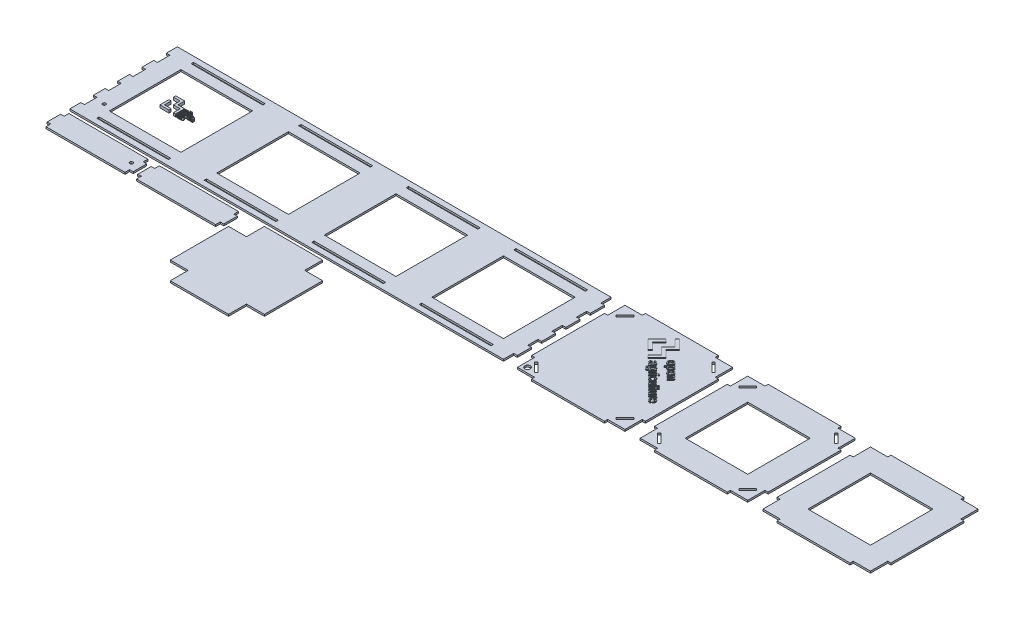
from build123d import *

# Parameters (mm, degrees)
BOSS_EXTRUDE1_DEPTH    = 2.54
SKETCH5_R              = 2.2225
SKETCH5_W              = 101.6
SKETCH5_H              = 3.302
SKETCH5_H_2            = 101.6
CUT_EXTRUDE2_DEPTH     = 394.536094914
BOSS_EXTRUDE2_DEPTH    = 2.54
SKETCH6_W              = 88.646
SKETCH6_H              = 88.646
BOSS_EXTRUDE2_2_DEPTH  = 2.54
BOSS_EXTRUDE2_3_DEPTH  = 2.54
BOSS_EXTRUDE3_DEPTH    = 2.54
BOSS_EXTRUDE3_2_DEPTH  = 2.54
CUT_EXTRUDE3_DEPTH     = 762.924925311
BOSS_EXTRUDE5_DEPTH    = 2.54
SKETCH14_R             = 2.2225
CUT_EXTRUDE4_DEPTH     = 784.538351062
BOSS_EXTRUDE7_DEPTH    = 3.81
BOSS_EXTRUDE7_2_DEPTH  = 3.81
BOSS_EXTRUDE7_3_DEPTH  = 3.81
BOSS_EXTRUDE7_4_DEPTH  = 3.81
BOSS_EXTRUDE7_5_DEPTH  = 3.81
SKETCH13_W             = 0.88903339
SKETCH13_H             = 0.770495606
BOSS_EXTRUDE7_6_DEPTH  = 3.81
SKETCH13_H_2           = 3.378326885
BOSS_EXTRUDE7_7_DEPTH  = 3.81
BOSS_EXTRUDE7_8_DEPTH  = 3.81
BOSS_EXTRUDE7_9_DEPTH  = 3.81
BOSS_EXTRUDE7_10_DEPTH = 3.81
BOSS_EXTRUDE7_11_DEPTH = 3.81
SKETCH13_W_2           = 0.889033391
SKETCH13_H_3           = 0.770495605
BOSS_EXTRUDE7_12_DEPTH = 3.81
SKETCH13_H_4           = 3.378326886
BOSS_EXTRUDE7_13_DEPTH = 3.81
BOSS_EXTRUDE7_14_DEPTH = 3.81
SKETCH13_H_5           = 4.622973633
BOSS_EXTRUDE7_15_DEPTH = 3.81
BOSS_EXTRUDE7_16_DEPTH = 3.81
BOSS_EXTRUDE7_17_DEPTH = 3.81
BOSS_EXTRUDE7_18_DEPTH = 3.81
BOSS_EXTRUDE7_19_DEPTH = 3.81
BOSS_EXTRUDE7_20_DEPTH = 3.81
BOSS_EXTRUDE7_21_DEPTH = 3.81
BOSS_EXTRUDE7_22_DEPTH = 3.81
BOSS_EXTRUDE7_23_DEPTH = 3.81
BOSS_EXTRUDE7_24_DEPTH = 3.81
BOSS_EXTRUDE7_25_DEPTH = 3.81
BOSS_EXTRUDE7_26_DEPTH = 3.81
BOSS_EXTRUDE7_27_DEPTH = 3.81
BOSS_EXTRUDE7_28_DEPTH = 3.81
BOSS_EXTRUDE7_29_DEPTH = 3.81
BOSS_EXTRUDE7_30_DEPTH = 3.81
BOSS_EXTRUDE7_31_DEPTH = 3.81
BOSS_EXTRUDE7_32_DEPTH = 3.81
BOSS_EXTRUDE7_33_DEPTH = 3.81
SKETCH15_R             = 3.8725
CUT_EXTRUDE5_DEPTH     = 784.538351063


with BuildPart() as part:
    # Sketch1 → Boss-Extrude1 (new body)
    with BuildSketch(Plane(origin=(0, 0, 0), x_dir=(1, 0, 0), z_dir=(0, 1, 0))):
        Polygon((76.2, 76.2), (228.6, 76.2), (228.6, 61.6712), (233.68, 61.6712), (233.68, 41.7322), (228.6, 41.7322), (228.6, 27.2034), (233.68, 27.2034), (233.68, 7.2644), (228.6, 7.2644), (228.6, -7.2644), (233.68, -7.2644), (233.68, -27.2034), (228.6, -27.2034), (228.6, -41.7322), (233.68, -41.7322), (233.68, -61.6712), (228.6, -61.6712), (228.6, -76.2), (76.2, -76.2), (-76.2, -76.2), (-228.6, -76.2), (-381, -76.2), (-386.08, -76.2), (-386.08, -60.5917), (-381, -60.5917), (-381, -42.8117), (-386.08, -42.8117), (-386.08, -26.1239), (-381, -26.1239), (-381, -8.3439), (-386.08, -8.3439), (-386.08, 8.3439), (-381, 8.3439), (-381, 26.1239), (-386.08, 26.1239), (-386.08, 42.8117), (-381, 42.8117), (-381, 60.5917), (-386.08, 60.5917), (-386.08, 76.2), (-381, 76.2), (-228.6, 76.2), (-76.2, 76.2), align=None)
    extrude(amount=BOSS_EXTRUDE1_DEPTH)

    # Sketch5 → Cut-Extrude2 (cut, through all)
    with BuildSketch(Plane(origin=(0, 2.54, 0), x_dir=(1, 0, 0), z_dir=(0, 1, 0))):
        with Locations((-367.6, -45.8)):
            Circle(SKETCH5_R)
        with Locations((-304.8, -66.929)):
            Rectangle(SKETCH5_W, SKETCH5_H)
        with Locations((-152.4, -66.929)):
            Rectangle(SKETCH5_W, SKETCH5_H)
        with Locations((0, -66.929)):
            Rectangle(SKETCH5_W, SKETCH5_H)
        with Locations((152.4, -66.929)):
            Rectangle(SKETCH5_W, SKETCH5_H)
        with Locations((152.4, 66.929)):
            Rectangle(SKETCH5_W, SKETCH5_H)
        with Locations((0, 66.929)):
            Rectangle(SKETCH5_W, SKETCH5_H)
        with Locations((-152.4, 66.929)):
            Rectangle(SKETCH5_W, SKETCH5_H)
        with Locations((-304.8, 66.929)):
            Rectangle(SKETCH5_W, SKETCH5_H)
        with Locations((-304.8, 0)):
            Rectangle(SKETCH5_W, SKETCH5_H_2)
        with Locations((-152.4, 0)):
            Rectangle(SKETCH5_W, SKETCH5_H_2)
        Rectangle(SKETCH5_W, SKETCH5_H_2)
        with Locations((152.4, 0)):
            Rectangle(SKETCH5_W, SKETCH5_H_2)
    extrude(amount=-CUT_EXTRUDE2_DEPTH, mode=Mode.SUBTRACT)


with BuildPart() as body_2:
    # Sketch6 → Boss-Extrude2 (new body)
    with BuildSketch(Plane(origin=(0, 0, 0), x_dir=(1, 0, 0), z_dir=(0, 1, 0))):
        Polygon((248.376889261, 51.689), (248.376889261, 76.2), (272.887889261, 76.2), (272.887889261, 80.645), (376.265889261, 80.645), (376.265889261, 76.2), (400.776889261, 76.2), (400.776889261, 51.689), (405.221889261, 51.689), (405.221889261, -51.689), (400.776889261, -51.689), (400.776889261, -76.2), (376.265889261, -76.2), (376.265889261, -80.645), (272.887889261, -80.645), (272.887889261, -76.2), (248.376889261, -76.2), (248.376889261, -51.689), (243.931889261, -51.689), (243.931889261, 51.689), align=None)
    extrude(amount=BOSS_EXTRUDE2_DEPTH)


with BuildPart() as body_3:
    # Sketch6 → Boss-Extrude2 2 (new body)
    with BuildSketch(Plane(origin=(0, 0, 0), x_dir=(1, 0, 0), z_dir=(0, 1, 0))):
        Polygon((417.921889261, 51.689), (417.921889261, -51.689), (422.366889261, -51.689), (422.366889261, -76.2), (446.877889261, -76.2), (446.877889261, -80.645), (550.255889261, -80.645), (550.255889261, -76.2), (574.766889261, -76.2), (574.766889261, -51.689), (579.211889261, -51.689), (579.211889261, 51.689), (574.766889261, 51.689), (574.766889261, 76.2), (550.255889261, 76.2), (550.255889261, 80.645), (446.877889261, 80.645), (446.877889261, 76.2), (422.366889261, 76.2), (422.366889261, 51.689), align=None)
        with Locations((498.566889261, 0)):
            Rectangle(SKETCH6_W, SKETCH6_H, mode=Mode.SUBTRACT)
    extrude(amount=BOSS_EXTRUDE2_2_DEPTH)


with BuildPart() as body_4:
    # Sketch6 → Boss-Extrude2 3 (new body)
    with BuildSketch(Plane(origin=(0, 0, 0), x_dir=(1, 0, 0), z_dir=(0, 1, 0))):
        Polygon((591.911889261, 51.689), (591.911889261, -51.689), (596.356889261, -51.689), (596.356889261, -76.2), (620.867889261, -76.2), (620.867889261, -80.645), (724.245889261, -80.645), (724.245889261, -76.2), (748.756889261, -76.2), (748.756889261, -51.689), (753.201889261, -51.689), (753.201889261, 51.689), (748.756889261, 51.689), (748.756889261, 76.2), (724.245889261, 76.2), (724.245889261, 80.645), (620.867889261, 80.645), (620.867889261, 76.2), (596.356889261, 76.2), (596.356889261, 51.689), align=None)
        with Locations((672.556889261, 0)):
            Rectangle(SKETCH6_W, SKETCH6_H, mode=Mode.SUBTRACT)
    extrude(amount=BOSS_EXTRUDE2_3_DEPTH)


with BuildPart() as body_5:
    # Sketch7 → Boss-Extrude3 (new body)
    with BuildSketch(Plane(origin=(0, 0, 0), x_dir=(1, 0, 0), z_dir=(0, 1, 0))):
        Polygon((-381.08, -82.55), (-269.066, -82.55), (-269.066, -89.2175), (-264.066, -89.2175), (-264.066, -108.2675), (-269.066, -108.2675), (-269.066, -114.935), (-381.08, -114.935), (-381.08, -108.2675), (-386.08, -108.2675), (-386.08, -89.2175), (-381.08, -89.2175), align=None)
    extrude(amount=BOSS_EXTRUDE3_DEPTH)

    # Sketch14 → Cut-Extrude4 (cut, through all)
    with BuildSketch(Plane(origin=(0, 2.54, 0), x_dir=(1, 0, 0), z_dir=(0, 1, 0))):
        with Locations((-276.2885, -98.7425)):
            Circle(SKETCH14_R)
    extrude(amount=-CUT_EXTRUDE4_DEPTH, mode=Mode.SUBTRACT)


with BuildPart() as body_6:
    # Sketch7 → Boss-Extrude3 2 (new body)
    with BuildSketch(Plane(origin=(0, 0, 0), x_dir=(1, 0, 0), z_dir=(0, 1, 0))):
        Polygon((-252.716, -82.55), (-140.702, -82.55), (-140.702, -89.2175), (-135.702, -89.2175), (-135.702, -108.2675), (-140.702, -108.2675), (-140.702, -114.935), (-252.716, -114.935), (-252.716, -108.2675), (-257.716, -108.2675), (-257.716, -89.2175), (-252.716, -89.2175), align=None)
    extrude(amount=BOSS_EXTRUDE3_2_DEPTH)


with BuildPart() as cut_extrude3_tool:
    # Sketch8 → Cut-Extrude3 (new, through all)
    with BuildSketch(Plane(origin=(0, 2.54, 0), x_dir=(1, 0, 0), z_dir=(0, 1, 0))):
        Polygon((254.346209976, -57.658320715), (266.918568545, -70.230679285), (269.253435137, -67.895812693), (256.681076567, -55.323454124), align=None)
        Polygon((269.253435137, 67.895812693), (256.681076567, 55.323454124), (254.346209976, 57.658320715), (266.918568545, 70.230679285), align=None)
        Polygon((392.472701954, 55.323454124), (379.900343384, 67.895812693), (382.235209976, 70.230679285), (394.807568545, 57.658320715), align=None)
        Polygon((379.900343384, -67.895812693), (392.472701954, -55.323454124), (394.807568545, -57.658320715), (382.235209976, -70.230679285), align=None)
        Polygon((428.336209976, -57.658320715), (430.671076567, -55.323454124), (443.243435137, -67.895812693), (440.908568545, -70.230679285), align=None)
        Polygon((430.671076567, 55.323454124), (428.336209976, 57.658320715), (440.908568545, 70.230679285), (443.243435137, 67.895812693), align=None)
        Polygon((553.890343384, 67.895812693), (556.225209976, 70.230679285), (568.797568545, 57.658320715), (566.462701954, 55.323454124), align=None)
        Polygon((566.462701954, -55.323454124), (568.797568545, -57.658320715), (556.225209976, -70.230679285), (553.890343384, -67.895812693), align=None)
    extrude(amount=-CUT_EXTRUDE3_DEPTH)


with BuildPart() as body_2_1:
    add(body_2.part)

    # Cut-Extrude3: cut by cut_extrude3_tool
    add(cut_extrude3_tool.part, mode=Mode.SUBTRACT)

    # Sketch15 → Cut-Extrude5 (cut, through all)
    with BuildSketch(Plane(origin=(0, 2.54, 0), x_dir=(1, 0, 0), z_dir=(0, 1, 0))):
        with Locations((255.555994947, -69.020894314)):
            Circle(SKETCH15_R)
    extrude(amount=-CUT_EXTRUDE5_DEPTH, mode=Mode.SUBTRACT)


with BuildPart() as body_3_1:
    add(body_3.part)

    # Cut-Extrude3: cut by cut_extrude3_tool
    add(cut_extrude3_tool.part, mode=Mode.SUBTRACT)


with BuildPart() as body_7:
    # Sketch11 → Boss-Extrude5 (new body)
    with BuildSketch(Plane(origin=(0, 0, 0), x_dir=(1, 0, 0), z_dir=(0, 1, 0))):
        Polygon((-103.952, -107.95), (-129.352, -107.95), (-129.352, -190.5), (-103.952, -190.5), (-103.952, -215.9), (-21.402, -215.9), (-21.402, -190.5), (3.998, -190.5), (3.998, -107.95), (-21.402, -107.95), (-21.402, -82.55), (-103.952, -82.55), align=None)
    extrude(amount=BOSS_EXTRUDE5_DEPTH)


with BuildPart() as body_8:
    # Sketch13 → Boss-Extrude7 (new body)
    with BuildSketch(Plane(origin=(0, 0, 0), x_dir=(1, 0, 0), z_dir=(0, 1, 0))):
        Polygon((-325.872820865, 13.605305935), (-313.108156914, 13.605305935), (-313.108156914, 4.122337503), (-303.647820865, 4.122337503), (-303.647820865, -8.664958831), (-306.838986853, -8.664958831), (-306.838986853, 0.88590675), (-316.276690519, 0.88590675), (-316.276690519, 10.414139947), (-325.872820865, 10.414139947), align=None)
    extrude(amount=BOSS_EXTRUDE7_DEPTH)


with BuildPart() as body_9:
    # Sketch13 → Boss-Extrude7 2 (new body)
    with BuildSketch(Plane(origin=(0, 0, 0), x_dir=(1, 0, 0), z_dir=(0, 1, 0))):
        Polygon((330.121524008, 72.079612252), (343.015781778, 59.185354481), (333.436537087, 49.60610979), (342.992919619, 40.049727258), (330.07579969, 27.132607328), (326.852235247, 30.356171771), (336.500066416, 40.004002939), (326.966546043, 49.537523312), (336.591515052, 59.162492322), (326.897959565, 68.856047809), align=None)
    extrude(amount=BOSS_EXTRUDE7_2_DEPTH)


with BuildPart() as body_10:
    # Sketch13 → Boss-Extrude7 3 (new body)
    with BuildSketch(Plane(origin=(0, 0, 0), x_dir=(1, 0, 0), z_dir=(0, 1, 0))):
        Polygon((320.542279317, 62.50036756), (323.788705918, 59.253940958), (314.118012591, 49.583247631), (323.765843759, 39.935416462), (320.519417157, 36.68898986), (307.625159387, 49.583247631), align=None)
    extrude(amount=BOSS_EXTRUDE7_3_DEPTH)


with BuildPart() as body_11:
    # Sketch13 → Boss-Extrude7 4 (new body)
    with BuildSketch(Plane(origin=(0, 0, 0), x_dir=(1, 0, 0), z_dir=(0, 1, 0))):
        Polygon((-325.872820865, 4.122337503), (-322.659022494, 4.122337503), (-322.659022494, -5.45116046), (-313.108156914, -5.45116046), (-313.108156914, -8.664958831), (-325.872820865, -8.664958831), align=None)
    extrude(amount=BOSS_EXTRUDE7_4_DEPTH)


with BuildPart() as body_12:
    # Sketch13 → Boss-Extrude7 5 (new body)
    with BuildSketch(Plane(origin=(0, 0, 0), x_dir=(1, 0, 0), z_dir=(0, 1, 0))):
        with BuildLine():
            Line((-302.426894154, 4.264233635), (-301.537860763, 4.264233635))
            Line((-301.537860763, 4.264233635), (-301.537860763, 3.811382252))
            add(Edge.make_bspline(
                [(-301.537860763, 3.811382252), (-301.502895031, 3.852310341), (-301.434692637, 3.932142611), (-301.320556214, 4.03587056), (-301.202552403, 4.125036604), (-301.0791914, 4.197473168), (-300.950604169, 4.254142303), (-300.816764907, 4.293612215), (-300.677849402, 4.318659422), (-300.583490515, 4.321877586), (-300.535846045, 4.323502528)],
                knots=[0, 0, 0, 0, 1.107989097, 2.161187726, 3.169782568, 4.150299753, 5.101422349, 6.057126037, 7.018988, 8, 8, 8, 8], degree=3))
            add(Edge.make_bspline(
                [(-300.535846045, 4.323502528), (-300.486073961, 4.321773769), (-300.389059524, 4.318404117), (-300.24825505, 4.295961018), (-300.1184572, 4.25432047), (-299.998465801, 4.198714982), (-299.888678931, 4.12660037), (-299.789823849, 4.037375954), (-299.700912319, 3.932024757), (-299.652264179, 3.852225283), (-299.627365049, 3.811382252)],
                knots=[0, 0, 0, 0, 1.087442074, 2.119613481, 3.102840357, 4.056171906, 5.000733146, 5.960649063, 6.95621775, 8, 8, 8, 8], degree=3))
            add(Edge.make_bspline(
                [(-299.627365049, 3.811382252), (-299.590810039, 3.852299389), (-299.5192651, 3.932381822), (-299.401181784, 4.036324216), (-299.280241396, 4.126193644), (-299.153573139, 4.197459891), (-299.02255945, 4.253693523), (-298.887652186, 4.294893257), (-298.747482211, 4.31836344), (-298.652908476, 4.321773993), (-298.604976649, 4.323502528)],
                knots=[0, 0, 0, 0, 1.113435884, 2.179200698, 3.188655475, 4.168472025, 5.123401892, 6.079401341, 7.026602871, 8, 8, 8, 8], degree=3))
            add(Edge.make_bspline(
                [(-298.604976649, 4.323502528), (-298.545892966, 4.321913667), (-298.431298953, 4.318832038), (-298.266852662, 4.289796109), (-298.116265878, 4.24239434), (-297.980236946, 4.176678266), (-297.85867627, 4.092526131), (-297.754482659, 3.989369527), (-297.665085864, 3.869101749), (-297.6215579, 3.778273079), (-297.599257626, 3.731739677)],
                knots=[0, 0, 0, 0, 1.140878793, 2.212757745, 3.214472279, 4.182883268, 5.121137096, 6.057549851, 7.004842706, 8, 8, 8, 8], degree=3))
            add(Edge.make_bspline(
                [(-297.599257626, 3.731739677), (-297.591852578, 3.712395602), (-297.576303161, 3.671776134), (-297.558023772, 3.605110611), (-297.54266272, 3.530522088), (-297.529637006, 3.447390344), (-297.519853715, 3.356211304), (-297.512114837, 3.256473863), (-297.50910928, 3.148636909), (-297.508098196, 3.073916783), (-297.507576057, 3.035330188)],
                knots=[0, 0, 0, 0, 0.70348757, 1.477211565, 2.345356006, 3.290383569, 4.335215205, 5.460703428, 6.68866909, 8, 8, 8, 8], degree=3))
            Line((-297.507576057, 3.035330188), (-297.507576057, 0.88590675))
            Line((-297.507576057, 0.88590675), (-298.396609448, 0.88590675))
            Line((-298.396609448, 0.88590675), (-298.396609448, 2.826962987))
            add(Edge.make_bspline(
                [(-298.396609448, 2.826962987), (-298.397127395, 2.867093149), (-298.398119673, 2.943974243), (-298.401097585, 3.053663151), (-298.40866961, 3.152193487), (-298.418570741, 3.239355635), (-298.431203864, 3.31551802), (-298.446811237, 3.380524048), (-298.464351586, 3.435067837), (-298.48079336, 3.46582241), (-298.488291017, 3.479846883)],
                knots=[0, 0, 0, 0, 1.448583407, 2.775186282, 3.959557885, 5.014017743, 5.940851432, 6.743435621, 7.42699079, 8, 8, 8, 8], degree=3))
            add(Edge.make_bspline(
                [(-298.488291017, 3.479846883), (-298.498649313, 3.495320639), (-298.518984665, 3.525698633), (-298.556599528, 3.564589538), (-298.597947695, 3.597717173), (-298.643643519, 3.62439972), (-298.692917924, 3.646129911), (-298.74662839, 3.66063507), (-298.804344716, 3.67036792), (-298.844478231, 3.671143948), (-298.865204131, 3.671544708)],
                knots=[0, 0, 0, 0, 1.007330723, 1.977586358, 2.91811154, 3.870610884, 4.837109745, 5.827490497, 6.87806446, 8, 8, 8, 8], degree=3))
            add(Edge.make_bspline(
                [(-298.865204131, 3.671544708), (-298.895885068, 3.670057726), (-298.957059764, 3.667092833), (-299.04721859, 3.644931795), (-299.13431622, 3.608238438), (-299.216955533, 3.557326231), (-299.293999844, 3.493983064), (-299.357985967, 3.414106272), (-299.41256359, 3.322534658), (-299.446608242, 3.235299866), (-299.468416505, 3.157112103), (-299.482889666, 3.089344233), (-299.496291985, 3.013770894), (-299.504481779, 2.929501107), (-299.513453055, 2.83790599), (-299.518423111, 2.73778999), (-299.522518442, 2.630051794), (-299.522650313, 2.555318817), (-299.52271841, 2.516727376)],
                knots=[0, 0, 0, 0, 0.980756864, 1.955530408, 2.951333081, 3.992841588, 5.051067304, 6.124479263, 7.24895299, 8.449987866, 9.106471564, 9.844417254, 10.665838362, 11.560007627, 12.551443477, 13.609669193, 14.765654547, 16, 16, 16, 16], degree=3))
            Line((-299.52271841, 2.516727376), (-299.52271841, 0.88590675))
            Line((-299.52271841, 0.88590675), (-300.411751801, 0.88590675))
            Line((-300.411751801, 0.88590675), (-300.411751801, 2.747320412))
            add(Edge.make_bspline(
                [(-300.411751801, 2.747320412), (-300.412001649, 2.786833539), (-300.412477947, 2.862159668), (-300.414072579, 2.96960469), (-300.417559817, 3.065960354), (-300.423363722, 3.151140446), (-300.429316203, 3.225657363), (-300.437733471, 3.288934006), (-300.446393931, 3.341704545), (-300.461052313, 3.395878883), (-300.482429236, 3.453170066), (-300.516173796, 3.511798975), (-300.555238769, 3.562395889), (-300.602496716, 3.602985495), (-300.657667151, 3.633946748), (-300.720830074, 3.656407694), (-300.792806424, 3.668922252), (-300.843564013, 3.670643054), (-300.870159643, 3.671544708)],
                knots=[0, 0, 0, 0, 1.59971622, 3.049630259, 4.350321007, 5.502524502, 6.50613666, 7.375761863, 8.086687183, 8.668722719, 9.645840515, 10.55265597, 11.397779758, 12.221945254, 13.055906891, 13.945332132, 14.923408514, 16, 16, 16, 16], degree=3))
            add(Edge.make_bspline(
                [(-300.870159643, 3.671544708), (-300.903289629, 3.670020259), (-300.968336041, 3.667027203), (-301.063539585, 3.646281327), (-301.153109725, 3.610620827), (-301.23661623, 3.561432069), (-301.312450521, 3.499313183), (-301.376704139, 3.423048055), (-301.430040616, 3.335045242), (-301.463742253, 3.251667616), (-301.485607769, 3.176687149), (-301.498971999, 3.110618628), (-301.510992761, 3.036168963), (-301.521206236, 2.95309466), (-301.528228193, 2.860993733), (-301.53366237, 2.760334868), (-301.537639976, 2.651039518), (-301.5377854, 2.57538273), (-301.537860763, 2.536174982)],
                knots=[0, 0, 0, 0, 1.061105177, 2.08334182, 3.104381884, 4.137278018, 5.176827868, 6.229094397, 7.316239487, 8.460364206, 9.09881589, 9.816452537, 10.617971519, 11.514628853, 12.496857794, 13.576419947, 14.74402393, 16, 16, 16, 16], degree=3))
            Line((-301.537860763, 2.536174982), (-301.537860763, 0.88590675))
            Line((-301.537860763, 0.88590675), (-302.426894154, 0.88590675))
            Line((-302.426894154, 0.88590675), (-302.426894154, 4.264233635))
        make_face()
    extrude(amount=BOSS_EXTRUDE7_5_DEPTH)


with BuildPart() as body_13:
    # Sketch13 → Boss-Extrude7 6 (new body)
    with BuildSketch(Plane(origin=(0, 0, 0), x_dir=(1, 0, 0), z_dir=(0, 1, 0))):
        with Locations((-296.174025971, 5.12363258)):
            Rectangle(SKETCH13_W, SKETCH13_H)
    extrude(amount=BOSS_EXTRUDE7_6_DEPTH)


with BuildPart() as body_14:
    # Sketch13 → Boss-Extrude7 7 (new body)
    with BuildSketch(Plane(origin=(0, 0, 0), x_dir=(1, 0, 0), z_dir=(0, 1, 0))):
        with Locations((-296.174025971, 2.575070193)):
            Rectangle(SKETCH13_W, SKETCH13_H_2)
    extrude(amount=BOSS_EXTRUDE7_7_DEPTH)


with BuildPart() as body_15:
    # Sketch13 → Boss-Extrude7 8 (new body)
    with BuildSketch(Plane(origin=(0, 0, 0), x_dir=(1, 0, 0), z_dir=(0, 1, 0))):
        with BuildLine():
            Line((-293.240215781, 4.264233635), (-293.240215781, 3.612275815))
            Line((-293.240215781, 3.612275815), (-293.892173601, 3.612275815))
            Line((-293.892173601, 3.612275815), (-293.892173601, 2.160187943))
            add(Edge.make_bspline(
                [(-293.892173601, 2.160187943), (-293.892241251, 2.12530566), (-293.892368772, 2.059552556), (-293.891529859, 1.966628533), (-293.889558126, 1.885137382), (-293.887510652, 1.815075158), (-293.886480799, 1.756347289), (-293.882478198, 1.709441345), (-293.878842109, 1.673949111), (-293.873199098, 1.630238679), (-293.847279107, 1.57735965), (-293.804230097, 1.531143759), (-293.759977373, 1.50431651), (-293.722413057, 1.489517384), (-293.681510727, 1.479856241), (-293.652992786, 1.479021818), (-293.638428654, 1.478595677)],
                knots=[0, 0, 0, 0, 1.772607892, 3.341365874, 4.72216035, 5.914769548, 6.903535532, 7.706019004, 8.305410619, 8.718065781, 9.939723765, 11.215765275, 11.877591902, 12.553399735, 13.261220211, 14, 14, 14, 14], degree=3))
            add(Edge.make_bspline(
                [(-293.638428654, 1.478595677), (-293.614601397, 1.479943264), (-293.561910754, 1.482923264), (-293.476420887, 1.500044469), (-293.377338018, 1.527292194), (-293.307387895, 1.551047036), (-293.269850227, 1.56379471)],
                knots=[0, 0, 0, 0, 0.753421026, 1.666085143, 2.747540144, 4, 4, 4, 4], degree=3))
            Line((-293.269850227, 1.56379471), (-293.180946888, 0.944249566))
            add(Edge.make_bspline(
                [(-293.180946888, 0.944249566), (-293.234934378, 0.925728465), (-293.344759434, 0.888051572), (-293.519692351, 0.85377365), (-293.704161352, 0.83049135), (-293.830972717, 0.827942448), (-293.895877907, 0.826637857)],
                knots=[0, 0, 0, 0, 0.939547081, 1.911291127, 2.930947196, 4, 4, 4, 4], degree=3))
            add(Edge.make_bspline(
                [(-293.895877907, 0.826637857), (-293.935740133, 0.827822309), (-294.013583282, 0.830135311), (-294.127571198, 0.844796123), (-294.235235077, 0.870791197), (-294.335801213, 0.906620093), (-294.426622347, 0.950648289), (-294.506612906, 1.00006889), (-294.572227861, 1.05756423), (-294.627036869, 1.12102397), (-294.670267701, 1.194708885), (-294.704588419, 1.278558756), (-294.734084155, 1.372942877), (-294.74616726, 1.440446555), (-294.752498622, 1.475817448)],
                knots=[0, 0, 0, 0, 1.203015215, 2.349253984, 3.460901624, 4.539344044, 5.564274864, 6.502382232, 7.367332183, 8.186789841, 9.022345106, 9.932420497, 10.916620053, 12, 12, 12, 12], degree=3))
            add(Edge.make_bspline(
                [(-294.752498622, 1.475817448), (-294.754718619, 1.490625667), (-294.759657738, 1.52357146), (-294.76635906, 1.578161639), (-294.770494042, 1.643093167), (-294.773882514, 1.718133578), (-294.77822907, 1.803298735), (-294.779148046, 1.898422072), (-294.781807777, 2.003669144), (-294.781413864, 2.077147546), (-294.781206992, 2.115736274)],
                knots=[0, 0, 0, 0, 0.560521704, 1.24706641, 2.057998689, 2.995119087, 4.059211621, 5.249632546, 6.555586685, 8, 8, 8, 8], degree=3))
            Line((-294.781206992, 2.115736274), (-294.781206992, 3.612275815))
            Line((-294.781206992, 3.612275815), (-295.196089241, 3.612275815))
            Line((-295.196089241, 3.612275815), (-295.196089241, 4.264233635))
            Line((-295.196089241, 4.264233635), (-294.781206992, 4.264233635))
            Line((-294.781206992, 4.264233635), (-294.781206992, 4.916191455))
            Line((-294.781206992, 4.916191455), (-293.892173601, 5.44961149))
            Line((-293.892173601, 5.44961149), (-293.892173601, 4.264233635))
            Line((-293.892173601, 4.264233635), (-293.240215781, 4.264233635))
        make_face()
    extrude(amount=BOSS_EXTRUDE7_8_DEPTH)


with BuildPart() as body_16:
    # Sketch13 → Boss-Extrude7 9 (new body)
    with BuildSketch(Plane(origin=(0, 0, 0), x_dir=(1, 0, 0), z_dir=(0, 1, 0))):
        with BuildLine():
            Line((-302.426894154, -0.033662212), (-301.537860763, -0.033662212))
            Line((-301.537860763, -0.033662212), (-301.537860763, -0.486513596))
            add(Edge.make_bspline(
                [(-301.537860763, -0.486513596), (-301.502895031, -0.445585506), (-301.434692637, -0.365753236), (-301.320556214, -0.262025287), (-301.202552403, -0.172859243), (-301.0791914, -0.100422679), (-300.950604169, -0.043753544), (-300.816764907, -0.004283632), (-300.677849402, 0.020763574), (-300.583490515, 0.023981738), (-300.535846045, 0.025606681)],
                knots=[0, 0, 0, 0, 1.107989097, 2.161187726, 3.169782568, 4.150299753, 5.101422349, 6.057126037, 7.018988, 8, 8, 8, 8], degree=3))
            add(Edge.make_bspline(
                [(-300.535846045, 0.025606681), (-300.486073961, 0.023877921), (-300.389059524, 0.020508269), (-300.24825505, -0.00193483), (-300.1184572, -0.043575378), (-299.998465801, -0.099180865), (-299.888678931, -0.171295477), (-299.789823849, -0.260519894), (-299.700912319, -0.36587109), (-299.652264179, -0.445670564), (-299.627365049, -0.486513596)],
                knots=[0, 0, 0, 0, 1.087442074, 2.119613481, 3.102840357, 4.056171906, 5.000733146, 5.960649063, 6.95621775, 8, 8, 8, 8], degree=3))
            add(Edge.make_bspline(
                [(-299.627365049, -0.486513596), (-299.590810039, -0.445596458), (-299.5192651, -0.365514026), (-299.401181784, -0.261571632), (-299.280241396, -0.171702204), (-299.153573139, -0.100435956), (-299.02255945, -0.044202325), (-298.887652186, -0.003002591), (-298.747482211, 0.020467593), (-298.652908476, 0.023878145), (-298.604976649, 0.025606681)],
                knots=[0, 0, 0, 0, 1.113435884, 2.179200698, 3.188655475, 4.168472025, 5.123401892, 6.079401341, 7.026602871, 8, 8, 8, 8], degree=3))
            add(Edge.make_bspline(
                [(-298.604976649, 0.025606681), (-298.545892966, 0.024017819), (-298.431298953, 0.02093619), (-298.266852662, -0.008099739), (-298.116265878, -0.055501507), (-297.980236946, -0.121217582), (-297.85867627, -0.205369717), (-297.754482659, -0.30852632), (-297.665085864, -0.428794099), (-297.6215579, -0.519622769), (-297.599257626, -0.56615617)],
                knots=[0, 0, 0, 0, 1.140878793, 2.212757745, 3.214472279, 4.182883268, 5.121137096, 6.057549851, 7.004842706, 8, 8, 8, 8], degree=3))
            add(Edge.make_bspline(
                [(-297.599257626, -0.56615617), (-297.591852578, -0.585500245), (-297.576303161, -0.626119714), (-297.558023772, -0.692785236), (-297.54266272, -0.767373759), (-297.529637006, -0.850505504), (-297.519853715, -0.941684544), (-297.512114837, -1.041421985), (-297.50910928, -1.149258939), (-297.508098196, -1.223979064), (-297.507576057, -1.26256566)],
                knots=[0, 0, 0, 0, 0.70348757, 1.477211565, 2.345356006, 3.290383569, 4.335215205, 5.460703428, 6.68866909, 8, 8, 8, 8], degree=3))
            Line((-297.507576057, -1.26256566), (-297.507576057, -3.411989098))
            Line((-297.507576057, -3.411989098), (-298.396609448, -3.411989098))
            Line((-298.396609448, -3.411989098), (-298.396609448, -1.470932861))
            add(Edge.make_bspline(
                [(-298.396609448, -1.470932861), (-298.397127395, -1.430802698), (-298.398119673, -1.353921604), (-298.401097585, -1.244232696), (-298.40866961, -1.14570236), (-298.418570741, -1.058540213), (-298.431203864, -0.982377828), (-298.446811237, -0.917371799), (-298.464351586, -0.86282801), (-298.48079336, -0.832073438), (-298.488291017, -0.818048964)],
                knots=[0, 0, 0, 0, 1.448583407, 2.775186282, 3.959557885, 5.014017743, 5.940851432, 6.743435621, 7.42699079, 8, 8, 8, 8], degree=3))
            add(Edge.make_bspline(
                [(-298.488291017, -0.818048964), (-298.498649313, -0.802575209), (-298.518984665, -0.772197214), (-298.556599528, -0.733306309), (-298.597947695, -0.700178674), (-298.643643519, -0.673496127), (-298.692917924, -0.651765936), (-298.74662839, -0.637260777), (-298.804344716, -0.627527927), (-298.844478231, -0.626751899), (-298.865204131, -0.62635114)],
                knots=[0, 0, 0, 0, 1.007330723, 1.977586358, 2.91811154, 3.870610884, 4.837109745, 5.827490497, 6.87806446, 8, 8, 8, 8], degree=3))
            add(Edge.make_bspline(
                [(-298.865204131, -0.62635114), (-298.895885068, -0.627838122), (-298.957059764, -0.630803014), (-299.04721859, -0.652964052), (-299.13431622, -0.68965741), (-299.216955533, -0.740569616), (-299.293999844, -0.803912784), (-299.357985967, -0.883789576), (-299.41256359, -0.97536119), (-299.446608242, -1.062595981), (-299.468416505, -1.140783744), (-299.482889666, -1.208551614), (-299.496291985, -1.284124954), (-299.504481779, -1.36839474), (-299.513453055, -1.459989857), (-299.518423111, -1.560105857), (-299.522518442, -1.667844054), (-299.522650313, -1.742577031), (-299.52271841, -1.781168471)],
                knots=[0, 0, 0, 0, 0.980756864, 1.955530408, 2.951333081, 3.992841588, 5.051067304, 6.124479263, 7.24895299, 8.449987866, 9.106471564, 9.844417254, 10.665838362, 11.560007627, 12.551443477, 13.609669193, 14.765654547, 16, 16, 16, 16], degree=3))
            Line((-299.52271841, -1.781168471), (-299.52271841, -3.411989098))
            Line((-299.52271841, -3.411989098), (-300.411751801, -3.411989098))
            Line((-300.411751801, -3.411989098), (-300.411751801, -1.550575435))
            add(Edge.make_bspline(
                [(-300.411751801, -1.550575435), (-300.412001649, -1.511062308), (-300.412477947, -1.43573618), (-300.414072579, -1.328291157), (-300.417559817, -1.231935493), (-300.423363722, -1.146755402), (-300.429316203, -1.072238485), (-300.437733471, -1.008961841), (-300.446393931, -0.956191303), (-300.461052313, -0.902016964), (-300.482429236, -0.844725782), (-300.516173796, -0.786096873), (-300.555238769, -0.735499958), (-300.602496716, -0.694910353), (-300.657667151, -0.6639491), (-300.720830074, -0.641488153), (-300.792806424, -0.628973595), (-300.843564013, -0.627252794), (-300.870159643, -0.62635114)],
                knots=[0, 0, 0, 0, 1.59971622, 3.049630259, 4.350321007, 5.502524502, 6.50613666, 7.375761863, 8.086687183, 8.668722719, 9.645840515, 10.55265597, 11.397779758, 12.221945254, 13.055906891, 13.945332132, 14.923408514, 16, 16, 16, 16], degree=3))
            add(Edge.make_bspline(
                [(-300.870159643, -0.62635114), (-300.903289629, -0.627875588), (-300.968336041, -0.630868644), (-301.063539585, -0.651614521), (-301.153109725, -0.68727502), (-301.23661623, -0.736463778), (-301.312450521, -0.798582665), (-301.376704139, -0.874847793), (-301.430040616, -0.962850606), (-301.463742253, -1.046228231), (-301.485607769, -1.121208698), (-301.498971999, -1.187277219), (-301.510992761, -1.261726885), (-301.521206236, -1.344801187), (-301.528228193, -1.436902115), (-301.53366237, -1.537560979), (-301.537639976, -1.64685633), (-301.5377854, -1.722513118), (-301.537860763, -1.761720866)],
                knots=[0, 0, 0, 0, 1.061105177, 2.08334182, 3.104381884, 4.137278018, 5.176827868, 6.229094397, 7.316239487, 8.460364206, 9.09881589, 9.816452537, 10.617971519, 11.514628853, 12.496857794, 13.576419947, 14.74402393, 16, 16, 16, 16], degree=3))
            Line((-301.537860763, -1.761720866), (-301.537860763, -3.411989098))
            Line((-301.537860763, -3.411989098), (-302.426894154, -3.411989098))
            Line((-302.426894154, -3.411989098), (-302.426894154, -0.033662212))
        make_face()
    extrude(amount=BOSS_EXTRUDE7_9_DEPTH)


with BuildPart() as body_17:
    # Sketch13 → Boss-Extrude7 10 (new body)
    with BuildSketch(Plane(origin=(0, 0, 0), x_dir=(1, 0, 0), z_dir=(0, 1, 0))):
        with BuildLine():
            Line((-294.721938099, -2.345149029), (-293.832904708, -2.463686814))
            add(Edge.make_bspline(
                [(-293.832904708, -2.463686814), (-293.847446092, -2.503742384), (-293.876037552, -2.582500174), (-293.928274336, -2.694799296), (-293.986664778, -2.799609576), (-294.050928165, -2.897491013), (-294.120825335, -2.988571312), (-294.198667519, -3.070934532), (-294.280662609, -3.147646779), (-294.370240424, -3.215055265), (-294.465156469, -3.275677843), (-294.565887739, -3.328721956), (-294.673239805, -3.371921659), (-294.785587009, -3.408098487), (-294.903439308, -3.436974877), (-295.027277516, -3.457162313), (-295.15694275, -3.469427603), (-295.245452428, -3.470640173), (-295.290549039, -3.47125799)],
                knots=[0, 0, 0, 0, 1.071172907, 2.106154283, 3.1104349, 4.085737425, 5.048416355, 5.993087888, 6.932482331, 7.868664062, 8.80754521, 9.762367971, 10.726735429, 11.713584758, 12.728370439, 13.774815933, 14.866245336, 16, 16, 16, 16], degree=3))
            add(Edge.make_bspline(
                [(-295.290549039, -3.47125799), (-295.361020044, -3.469518635), (-295.497869374, -3.466140939), (-295.695858552, -3.43899766), (-295.879748405, -3.39480503), (-296.0498931, -3.332904647), (-296.205727111, -3.25170688), (-296.347485092, -3.152972169), (-296.47544505, -3.036485931), (-296.547166809, -2.946296921), (-296.583351761, -2.900794898)],
                knots=[0, 0, 0, 0, 1.150944905, 2.235047425, 3.25761485, 4.235688044, 5.185329112, 6.119879054, 7.051444229, 8, 8, 8, 8], degree=3))
            add(Edge.make_bspline(
                [(-296.583351761, -2.900794898), (-296.610056266, -2.862072952), (-296.663831341, -2.784098257), (-296.730675737, -2.657751828), (-296.787833284, -2.524280401), (-296.833368585, -2.38330166), (-296.871221038, -2.235351252), (-296.896688683, -2.079489253), (-296.911367459, -1.916042752), (-296.913698034, -1.804659292), (-296.91488713, -1.747829719)],
                knots=[0, 0, 0, 0, 0.92479112, 1.862259343, 2.806490716, 3.778329015, 4.774107667, 5.808532634, 6.881879269, 8, 8, 8, 8], degree=3))
            add(Edge.make_bspline(
                [(-296.91488713, -1.747829719), (-296.913909184, -1.680463396), (-296.911997406, -1.548769476), (-296.889363481, -1.357331629), (-296.857425717, -1.176301473), (-296.808718474, -1.007559717), (-296.747840936, -0.84918152), (-296.67143726, -0.703203546), (-296.583307737, -0.566970483), (-296.480264185, -0.444596725), (-296.367341043, -0.334563518), (-296.247169637, -0.237605801), (-296.118850355, -0.156620453), (-295.984294477, -0.089026344), (-295.841263098, -0.038430653), (-295.691546382, -0.001185582), (-295.534489717, 0.021496164), (-295.427374499, 0.024222137), (-295.372969843, 0.025606681)],
                knots=[0, 0, 0, 0, 1.222152375, 2.389176539, 3.494777592, 4.555389183, 5.572001132, 6.56945427, 7.540785438, 8.511469914, 9.46642023, 10.399267108, 11.30862844, 12.215760073, 13.126777173, 14.056336669, 15.012798191, 16, 16, 16, 16], degree=3))
            add(Edge.make_bspline(
                [(-295.372969843, 0.025606681), (-295.312079988, 0.024319294), (-295.192924925, 0.021800014), (-295.019197276, -0.001850748), (-294.855168483, -0.040319271), (-294.701374345, -0.095596331), (-294.556811992, -0.164911083), (-294.422556584, -0.250812723), (-294.29860123, -0.352516772), (-294.185252039, -0.469979866), (-294.082669089, -0.602429632), (-293.995355007, -0.752420922), (-293.922261053, -0.91840345), (-293.863002798, -1.100805142), (-293.819193862, -1.300007861), (-293.789217959, -1.515493199), (-293.772123195, -1.747241381), (-293.773121096, -1.907086951), (-293.773635815, -1.989535672)],
                knots=[0, 0, 0, 0, 0.994942504, 1.946998194, 2.860087576, 3.744358974, 4.613292, 5.475605888, 6.343365869, 7.228414471, 8.138836547, 9.075277299, 10.058013037, 11.098483422, 12.205225682, 13.387753975, 14.652597341, 16, 16, 16, 16], degree=3))
            Line((-293.773635815, -1.989535672), (-296.025853739, -1.989535672))
            add(Edge.make_bspline(
                [(-296.025853739, -1.989535672), (-296.024395731, -2.021356454), (-296.021556522, -2.083321722), (-296.010801843, -2.173898202), (-295.992183658, -2.258681972), (-295.967818482, -2.338187403), (-295.938845916, -2.412470287), (-295.901990518, -2.480817321), (-295.859528362, -2.544100432), (-295.810439433, -2.601287658), (-295.75669106, -2.652053099), (-295.699974425, -2.696666304), (-295.640376582, -2.73567701), (-295.576357782, -2.765347141), (-295.510046456, -2.79040022), (-295.440248871, -2.806458883), (-295.367432201, -2.817129831), (-295.317753865, -2.818566822), (-295.292401192, -2.81930017)],
                knots=[0, 0, 0, 0, 1.231756261, 2.398624542, 3.522625857, 4.583815436, 5.612473245, 6.600564899, 7.580690863, 8.554470542, 9.508734211, 10.435415665, 11.342824763, 12.255949018, 13.158633635, 14.07945191, 15.019874036, 16, 16, 16, 16], degree=3))
            add(Edge.make_bspline(
                [(-295.292401192, -2.81930017), (-295.258656971, -2.817803937), (-295.193299452, -2.814905956), (-295.099090984, -2.794601287), (-295.013612602, -2.758819059), (-294.93596863, -2.708934387), (-294.866880959, -2.642687479), (-294.808958105, -2.558308654), (-294.758314494, -2.458432129), (-294.734462522, -2.384152495), (-294.721938099, -2.345149029)],
                knots=[0, 0, 0, 0, 1.004430367, 1.945431754, 2.851730883, 3.749038912, 4.678525969, 5.68064125, 6.782128749, 8, 8, 8, 8], degree=3))
        make_face()
        with BuildLine():
            add(Edge.make_bspline(
                [(-294.662669206, -1.456115638), (-294.664199288, -1.423375625), (-294.667179229, -1.359612165), (-294.676899697, -1.266645197), (-294.693586441, -1.179993311), (-294.715534406, -1.099189189), (-294.744819819, -1.025227562), (-294.777515553, -0.955988581), (-294.817612697, -0.893628182), (-294.863544604, -0.838289642), (-294.911995613, -0.787708433), (-294.9655539, -0.745646881), (-295.01970764, -0.708004957), (-295.077257886, -0.677885062), (-295.137608437, -0.654873441), (-295.200556053, -0.637954708), (-295.266210686, -0.628888937), (-295.310589197, -0.627206426), (-295.333148555, -0.62635114)],
                knots=[0, 0, 0, 0, 1.317025077, 2.564998298, 3.752245872, 4.859831213, 5.924126069, 6.944952788, 7.932526842, 8.893486968, 9.832088588, 10.740700482, 11.624936399, 12.479435602, 13.343337491, 14.21592381, 15.09308328, 16, 16, 16, 16], degree=3))
            add(Edge.make_bspline(
                [(-295.333148555, -0.62635114), (-295.357257142, -0.627133712), (-295.404764317, -0.628675809), (-295.474432174, -0.638737711), (-295.540467099, -0.656584249), (-295.603372346, -0.680738634), (-295.663013107, -0.71254743), (-295.719390716, -0.751556995), (-295.772717268, -0.797278934), (-295.804848961, -0.8319183), (-295.821190844, -0.849535564)],
                knots=[0, 0, 0, 0, 1.043516863, 2.056302107, 3.038302912, 3.998520634, 4.966791607, 5.956307719, 6.960596886, 8, 8, 8, 8], degree=3))
            add(Edge.make_bspline(
                [(-295.821190844, -0.849535564), (-295.836422577, -0.868688076), (-295.867025027, -0.907167861), (-295.905837957, -0.970968874), (-295.939646714, -1.039164686), (-295.964841585, -1.113596515), (-295.986967794, -1.191852186), (-295.999946892, -1.275801914), (-296.008690201, -1.364244641), (-296.009628085, -1.42491358), (-296.01011044, -1.456115638)],
                knots=[0, 0, 0, 0, 0.903873942, 1.815995408, 2.755131859, 3.711650387, 4.716574161, 5.757841734, 6.846857195, 8, 8, 8, 8], degree=3))
            Line((-296.01011044, -1.456115638), (-294.662669206, -1.456115638))
        make_face(mode=Mode.SUBTRACT)
    extrude(amount=BOSS_EXTRUDE7_10_DEPTH)


with BuildPart() as body_18:
    # Sketch13 → Boss-Extrude7 11 (new body)
    with BuildSketch(Plane(origin=(0, 0, 0), x_dir=(1, 0, 0), z_dir=(0, 1, 0))):
        with BuildLine():
            Line((-290.098964466, -3.411989098), (-290.987997857, -3.411989098))
            Line((-290.987997857, -3.411989098), (-290.987997857, -2.923946809))
            add(Edge.make_bspline(
                [(-290.987997857, -2.923946809), (-291.020448467, -2.969388782), (-291.083521287, -3.057712344), (-291.196027603, -3.170898416), (-291.31417255, -3.26837794), (-291.442938016, -3.342353402), (-291.574498676, -3.400034492), (-291.707758664, -3.44115486), (-291.842134578, -3.466172451), (-291.932184545, -3.469566882), (-291.977047505, -3.47125799)],
                knots=[0, 0, 0, 0, 1.136300101, 2.208576455, 3.242281452, 4.249058783, 5.223933999, 6.165280663, 7.085941471, 8, 8, 8, 8], degree=3))
            add(Edge.make_bspline(
                [(-291.977047505, -3.47125799), (-292.021574819, -3.46976333), (-292.109600713, -3.466808541), (-292.239479973, -3.445368541), (-292.36413458, -3.407661427), (-292.4841651, -3.35667378), (-292.599130734, -3.291105712), (-292.708913433, -3.210776992), (-292.813731245, -3.115494908), (-292.913475496, -3.007021951), (-293.00390146, -2.884636643), (-293.084104046, -2.751019274), (-293.150841105, -2.605190153), (-293.205284041, -2.448200756), (-293.247792602, -2.279624642), (-293.278199116, -2.099739966), (-293.295489329, -1.908379912), (-293.298129619, -1.777190053), (-293.299484674, -1.709860585)],
                knots=[0, 0, 0, 0, 0.868680302, 1.717291116, 2.559594063, 3.404262612, 4.256691068, 5.136162843, 6.05305749, 7.01654586, 8.006773995, 9.017023416, 10.051895049, 11.130067211, 12.254925639, 13.440213999, 14.686262564, 16, 16, 16, 16], degree=3))
            add(Edge.make_bspline(
                [(-293.299484674, -1.709860585), (-293.298137416, -1.640988429), (-293.2955229, -1.507333658), (-293.278323496, -1.31318454), (-293.247882459, -1.132053762), (-293.205398316, -0.963461011), (-293.1510537, -0.807305146), (-293.084283949, -0.663800639), (-293.005430897, -0.533080825), (-292.914142616, -0.416368583), (-292.81420093, -0.312370323), (-292.706494461, -0.222362362), (-292.592554824, -0.145766618), (-292.472817719, -0.082051219), (-292.345757621, -0.033744778), (-292.212713649, -3.3088e-05), (-292.073514989, 0.022646966), (-291.978374981, 0.024606551), (-291.929817606, 0.025606681)],
                knots=[0, 0, 0, 0, 1.327136196, 2.575468729, 3.751890053, 4.862767969, 5.921925726, 6.933145827, 7.907387355, 8.856890668, 9.782390252, 10.681851331, 11.556239068, 12.423659137, 13.289752485, 14.16837887, 15.06518071, 16, 16, 16, 16], degree=3))
            add(Edge.make_bspline(
                [(-291.929817606, 0.025606681), (-291.88496924, 0.024163919), (-291.796609892, 0.021321419), (-291.666381807, -0.000746152), (-291.540920608, -0.036522094), (-291.420514711, -0.088611207), (-291.304009237, -0.153469388), (-291.192899502, -0.233749928), (-291.086119519, -0.328049579), (-291.021277312, -0.399721002), (-290.987997857, -0.436505467)],
                knots=[0, 0, 0, 0, 0.992399448, 1.955205421, 2.915485871, 3.87381908, 4.85285833, 5.861755538, 6.90257267, 8, 8, 8, 8], degree=3))
            Line((-290.987997857, -0.436505467), (-290.987997857, 1.210984535))
            Line((-290.987997857, 1.210984535), (-290.098964466, 1.210984535))
            Line((-290.098964466, 1.210984535), (-290.098964466, -3.411989098))
        make_face()
        with BuildLine():
            add(Edge.make_bspline(
                [(-292.410451283, -1.65892638), (-292.410319074, -1.703702745), (-292.410064479, -1.789928383), (-292.401890845, -1.9143633), (-292.3916343, -2.029122011), (-292.375437697, -2.134090768), (-292.356974625, -2.230052282), (-292.331571417, -2.315838969), (-292.303719043, -2.392956188), (-292.279452001, -2.438910516), (-292.26783551, -2.460908585)],
                knots=[0, 0, 0, 0, 1.306099746, 2.515150209, 3.637201974, 4.666415219, 5.613193253, 6.485405436, 7.274972403, 8, 8, 8, 8], degree=3))
            add(Edge.make_bspline(
                [(-292.26783551, -2.460908585), (-292.250668221, -2.489515208), (-292.217449794, -2.544868564), (-292.156841978, -2.617258025), (-292.093428858, -2.680575146), (-292.022596575, -2.730825172), (-291.94760771, -2.771369711), (-291.866830383, -2.798971689), (-291.781465609, -2.816354623), (-291.722772047, -2.818303199), (-291.692742035, -2.81930017)],
                knots=[0, 0, 0, 0, 1.120960711, 2.169040953, 3.168100815, 4.128109154, 5.080726846, 6.026866003, 6.990464429, 8, 8, 8, 8], degree=3))
            add(Edge.make_bspline(
                [(-291.692742035, -2.81930017), (-291.668625261, -2.818256555), (-291.621021713, -2.816196585), (-291.551062532, -2.804471322), (-291.484365115, -2.782441427), (-291.420539372, -2.752609306), (-291.35849191, -2.715464789), (-291.300209618, -2.668534477), (-291.244501382, -2.613518319), (-291.191656171, -2.550585679), (-291.143309004, -2.479204815), (-291.101624573, -2.398959818), (-291.066586518, -2.310062024), (-291.037081822, -2.213530451), (-291.014871966, -2.108444783), (-290.999853029, -1.995428906), (-290.988916887, -1.873987688), (-290.988310581, -1.79014728), (-290.987997857, -1.746903643)],
                knots=[0, 0, 0, 0, 0.808519481, 1.595918141, 2.367946092, 3.154732969, 3.953063559, 4.785064852, 5.655532678, 6.573390792, 7.534530006, 8.538576741, 9.596996712, 10.732480475, 11.917354949, 13.191565377, 14.551451138, 16, 16, 16, 16], degree=3))
            add(Edge.make_bspline(
                [(-290.987997857, -1.746903643), (-290.988419881, -1.699039947), (-290.989234848, -1.606610589), (-290.998579419, -1.47305055), (-291.01391543, -1.349588056), (-291.036093202, -1.236693426), (-291.063466321, -1.133956151), (-291.09769468, -1.041763848), (-291.137996806, -0.959652317), (-291.185823955, -0.88863789), (-291.238410261, -0.827573286), (-291.292497535, -0.772938421), (-291.351898424, -0.728327172), (-291.414020055, -0.69078894), (-291.480347216, -0.661790396), (-291.550469478, -0.641805942), (-291.623665467, -0.627908777), (-291.673845864, -0.626874317), (-291.69922457, -0.62635114)],
                knots=[0, 0, 0, 0, 1.538844071, 2.971654591, 4.302575584, 5.536777829, 6.668535022, 7.717613974, 8.694219699, 9.60272161, 10.461894315, 11.283130947, 12.06930595, 12.843865074, 13.612870817, 14.388700961, 15.185086457, 16, 16, 16, 16], degree=3))
            add(Edge.make_bspline(
                [(-291.69922457, -0.62635114), (-291.723969366, -0.626979454), (-291.772837945, -0.628220315), (-291.844402807, -0.640575242), (-291.912852851, -0.661052238), (-291.977880648, -0.690219926), (-292.040522257, -0.726503525), (-292.100004982, -0.771140279), (-292.155791292, -0.824678496), (-292.208282822, -0.885660065), (-292.257217629, -0.954021375), (-292.29725575, -1.031897058), (-292.332975437, -1.116520074), (-292.361362921, -1.209663589), (-292.383448325, -1.310648848), (-292.398632231, -1.419645279), (-292.409532871, -1.536464602), (-292.410138542, -1.617225227), (-292.410451283, -1.65892638)],
                knots=[0, 0, 0, 0, 0.844531552, 1.667868134, 2.47173451, 3.278912967, 4.096287191, 4.939765054, 5.812329042, 6.731790039, 7.685377109, 8.6758465, 9.71559549, 10.819442259, 11.996209133, 13.242749135, 14.576279701, 16, 16, 16, 16], degree=3))
        make_face(mode=Mode.SUBTRACT)
    extrude(amount=BOSS_EXTRUDE7_11_DEPTH)


with BuildPart() as body_19:
    # Sketch13 → Boss-Extrude7 12 (new body)
    with BuildSketch(Plane(origin=(0, 0, 0), x_dir=(1, 0, 0), z_dir=(0, 1, 0))):
        with Locations((-288.706145488, 0.825736733)):
            Rectangle(SKETCH13_W_2, SKETCH13_H_3)
    extrude(amount=BOSS_EXTRUDE7_12_DEPTH)


with BuildPart() as body_20:
    # Sketch13 → Boss-Extrude7 13 (new body)
    with BuildSketch(Plane(origin=(0, 0, 0), x_dir=(1, 0, 0), z_dir=(0, 1, 0))):
        with Locations((-288.706145488, -1.722825655)):
            Rectangle(SKETCH13_W_2, SKETCH13_H_4)
    extrude(amount=BOSS_EXTRUDE7_13_DEPTH)


with BuildPart() as body_21:
    # Sketch13 → Boss-Extrude7 14 (new body)
    with BuildSketch(Plane(origin=(0, 0, 0), x_dir=(1, 0, 0), z_dir=(0, 1, 0))):
        with BuildLine():
            Line((-286.779906474, -1.041233389), (-287.550402079, -0.922695603))
            add(Edge.make_bspline(
                [(-287.550402079, -0.922695603), (-287.538855092, -0.883642962), (-287.5162521, -0.807198213), (-287.474775245, -0.697652197), (-287.426206268, -0.596376999), (-287.372641574, -0.502162722), (-287.312430655, -0.416039311), (-287.246535863, -0.337782726), (-287.174584788, -0.2676608), (-287.09623356, -0.205130667), (-287.009974784, -0.14958271), (-286.91385037, -0.102489098), (-286.808004381, -0.062835606), (-286.69258543, -0.030968093), (-286.56778716, -0.004325619), (-286.432654344, 0.011984501), (-286.288058566, 0.023757875), (-286.18847921, 0.024978319), (-286.137209418, 0.025606681)],
                knots=[0, 0, 0, 0, 1.047140172, 2.049755565, 3.008539736, 3.933190086, 4.833981818, 5.707167246, 6.560530269, 7.413560864, 8.281243119, 9.193714071, 10.161006392, 11.183910126, 12.270717139, 13.439589873, 14.681737877, 16, 16, 16, 16], degree=3))
            add(Edge.make_bspline(
                [(-286.137209418, 0.025606681), (-286.090588509, 0.025347838), (-286.000384377, 0.02484702), (-285.869705233, 0.018281071), (-285.748230396, 0.007514738), (-285.6361188, -0.008399809), (-285.533000948, -0.027324853), (-285.439206164, -0.051323877), (-285.354455209, -0.0796454), (-285.256530992, -0.123670648), (-285.148966991, -0.185537311), (-285.036700717, -0.269541486), (-284.946629379, -0.365100397), (-284.887019304, -0.454287123), (-284.851815982, -0.53512491), (-284.826975315, -0.606347758), (-284.809127128, -0.689564377), (-284.791560295, -0.783583299), (-284.780780082, -0.888913232), (-284.77105124, -1.005580032), (-284.76578222, -1.133485288), (-284.765111898, -1.222740644), (-284.764764121, -1.269048195)],
                knots=[0, 0, 0, 0, 1.253259065, 2.424859341, 3.516580225, 4.530621704, 5.468151732, 6.333678254, 7.13150538, 7.867126506, 9.216626747, 10.459871386, 11.622324159, 12.731817101, 13.322505456, 13.989117254, 14.756090433, 15.607496751, 16.559714447, 17.600403876, 18.755039204, 20, 20, 20, 20], degree=3))
            Line((-284.764764121, -1.269048195), (-284.764764121, -2.307179894))
            add(Edge.make_bspline(
                [(-284.764764121, -2.307179894), (-284.764476143, -2.342987057), (-284.763920011, -2.412136401), (-284.762779991, -2.512209635), (-284.757617904, -2.604795352), (-284.752194444, -2.690007634), (-284.745946144, -2.768178945), (-284.737837707, -2.838948435), (-284.727691258, -2.902622498), (-284.711412673, -2.978668535), (-284.685227657, -3.070932948), (-284.642414774, -3.18152625), (-284.591057242, -3.296719111), (-284.549251943, -3.372764491), (-284.52768855, -3.411989098)],
                knots=[0, 0, 0, 0, 1.124218554, 2.171045354, 3.141373911, 4.034856482, 4.851737235, 5.603038048, 6.270604849, 6.87504238, 8.043824301, 9.276776929, 10.59534724, 12, 12, 12, 12], degree=3))
            Line((-284.52768855, -3.411989098), (-285.416721941, -3.411989098))
            add(Edge.make_bspline(
                [(-285.416721941, -3.411989098), (-285.423067487, -3.394140438), (-285.43697188, -3.355030368), (-285.455749813, -3.28947145), (-285.478253939, -3.213087361), (-285.493091092, -3.157970604), (-285.500994898, -3.128609704)],
                knots=[0, 0, 0, 0, 0.768508203, 1.683958961, 2.766236402, 4, 4, 4, 4], degree=3))
            add(Edge.make_bspline(
                [(-285.500994898, -3.128609704), (-285.5044024, -3.115647752), (-285.510570259, -3.09218555), (-285.51878952, -3.060274523), (-285.525915153, -3.035877551), (-285.530596878, -3.022100413), (-285.532481497, -3.016554454)],
                knots=[0, 0, 0, 0, 1.381357368, 2.500370598, 3.396327181, 4, 4, 4, 4], degree=3))
            add(Edge.make_bspline(
                [(-285.532481497, -3.016554454), (-285.570091475, -3.052814572), (-285.643687881, -3.123769531), (-285.763717624, -3.215663345), (-285.886345895, -3.294772358), (-286.01356481, -3.359334367), (-286.144417677, -3.409792674), (-286.28019994, -3.444978842), (-286.420185744, -3.466872703), (-286.515277943, -3.469788449), (-286.563204584, -3.47125799)],
                knots=[0, 0, 0, 0, 1.082260538, 2.117802027, 3.127898709, 4.103827344, 5.070056335, 6.029309159, 7.006768236, 8, 8, 8, 8], degree=3))
            add(Edge.make_bspline(
                [(-286.563204584, -3.47125799), (-286.604903987, -3.470292788), (-286.686349136, -3.468407604), (-286.805195169, -3.455954477), (-286.916908848, -3.432335843), (-287.022001844, -3.400924067), (-287.120729006, -3.361433341), (-287.212237316, -3.311816687), (-287.297063608, -3.25318655), (-287.374365919, -3.185757593), (-287.443649007, -3.111750879), (-287.504452721, -3.03300811), (-287.554752635, -2.948473314), (-287.596365525, -2.85977608), (-287.629289711, -2.766139886), (-287.652000558, -2.667990705), (-287.666477189, -2.565059157), (-287.6681068, -2.494914633), (-287.668939864, -2.459056432)],
                knots=[0, 0, 0, 0, 1.186431605, 2.317277787, 3.39378889, 4.430144672, 5.434756152, 6.413230964, 7.385260177, 8.362630794, 9.325691837, 10.265445477, 11.187216893, 12.118354241, 13.048828682, 14.005299944, 14.980300216, 16, 16, 16, 16], degree=3))
            add(Edge.make_bspline(
                [(-287.668939864, -2.459056432), (-287.667426813, -2.412013695), (-287.664457914, -2.319706796), (-287.638519615, -2.185603042), (-287.597901505, -2.058929406), (-287.540170628, -1.941274885), (-287.468336073, -1.83369279), (-287.381918359, -1.738732757), (-287.28216295, -1.657877671), (-287.16689147, -1.589213272), (-287.031696865, -1.531371798), (-286.873807703, -1.475650296), (-286.689379774, -1.42571072), (-286.557174329, -1.397138193), (-286.487266316, -1.382029522)],
                knots=[0, 0, 0, 0, 0.9565892, 1.877012003, 2.769038917, 3.656897043, 4.535078379, 5.39337207, 6.259743944, 7.138913465, 8.11486349, 9.247429708, 10.544487161, 12, 12, 12, 12], degree=3))
            add(Edge.make_bspline(
                [(-286.487266316, -1.382029522), (-286.439094746, -1.372227323), (-286.346366168, -1.353358436), (-286.213165999, -1.324988348), (-286.091477187, -1.296393487), (-285.981816143, -1.267344603), (-285.883023204, -1.240951788), (-285.796129457, -1.21435621), (-285.720792018, -1.187589104), (-285.675029366, -1.168587214), (-285.653797512, -1.159771174)],
                knots=[0, 0, 0, 0, 1.365613701, 2.628758346, 3.783158308, 4.837685682, 5.780080249, 6.623655076, 7.36143661, 8, 8, 8, 8], degree=3))
            Line((-285.653797512, -1.159771174), (-285.653797512, -1.075498217))
            add(Edge.make_bspline(
                [(-285.653797512, -1.075498217), (-285.654982178, -1.037717482), (-285.65718217, -0.96755651), (-285.679053742, -0.870268266), (-285.71702044, -0.790135968), (-285.762848565, -0.736728289), (-285.808190974, -0.70451029), (-285.848227931, -0.683068112), (-285.89514389, -0.665955706), (-285.948279839, -0.650788604), (-286.008549, -0.640424331), (-286.075255641, -0.631818272), (-286.148578584, -0.627595464), (-286.199561721, -0.62677725), (-286.226112757, -0.62635114)],
                knots=[0, 0, 0, 0, 1.600506204, 2.972230995, 4.195852174, 5.327580964, 5.908906329, 6.547275261, 7.247479517, 8.022494018, 8.887774365, 9.837646189, 10.873887764, 12, 12, 12, 12], degree=3))
            add(Edge.make_bspline(
                [(-286.226112757, -0.62635114), (-286.26139393, -0.627194182), (-286.328437301, -0.628796182), (-286.422917359, -0.646720502), (-286.506051817, -0.67481769), (-286.578111855, -0.716766164), (-286.64023306, -0.773752701), (-286.69432558, -0.847238499), (-286.742245595, -0.937543528), (-286.766880582, -1.005369837), (-286.779906474, -1.041233389)],
                knots=[0, 0, 0, 0, 1.120680009, 2.129582446, 3.045508635, 3.899130849, 4.760899303, 5.707254252, 6.787697471, 8, 8, 8, 8], degree=3))
        make_face()
        with BuildLine():
            add(Edge.make_bspline(
                [(-285.653797512, -1.811728994), (-285.684310175, -1.821151586), (-285.753032823, -1.842373774), (-285.868466912, -1.8735538), (-286.007606006, -1.906410467), (-286.13591551, -1.934840864), (-286.243026456, -1.957931911), (-286.318585894, -1.976811661), (-286.386674175, -1.994814051), (-286.447393117, -2.013719367), (-286.500823983, -2.031515485), (-286.546188904, -2.050584449), (-286.585066884, -2.067282102), (-286.606873028, -2.08126103), (-286.616917019, -2.087699776)],
                knots=[0, 0, 0, 0, 1.144223484, 2.577096135, 4.283377528, 6.266557578, 7.286341447, 8.209198618, 9.057088726, 9.80932547, 10.487940513, 11.073343897, 11.57317876, 12, 12, 12, 12], degree=3))
            add(Edge.make_bspline(
                [(-286.616917019, -2.087699776), (-286.641782089, -2.107283626), (-286.689501227, -2.144867452), (-286.741520618, -2.21749739), (-286.774530191, -2.298018445), (-286.778092435, -2.355017839), (-286.779906474, -2.384044239)],
                knots=[0, 0, 0, 0, 1.075028234, 2.063111864, 3.013658082, 4, 4, 4, 4], degree=3))
            add(Edge.make_bspline(
                [(-286.779906474, -2.384044239), (-286.778306485, -2.412924888), (-286.775167986, -2.469576466), (-286.750169745, -2.551209157), (-286.7081327, -2.625997266), (-286.650878801, -2.692483274), (-286.581985035, -2.750042848), (-286.500775126, -2.789494588), (-286.411306562, -2.814969059), (-286.34854027, -2.817819681), (-286.315942173, -2.81930017)],
                knots=[0, 0, 0, 0, 0.976809721, 1.916086158, 2.861451878, 3.862738809, 4.873423621, 5.878632484, 6.898253484, 8, 8, 8, 8], degree=3))
            add(Edge.make_bspline(
                [(-286.315942173, -2.81930017), (-286.278693233, -2.817614717), (-286.203704081, -2.814221581), (-286.093722612, -2.783218529), (-285.985136725, -2.737458469), (-285.919204073, -2.692422799), (-285.885316624, -2.669275786)],
                knots=[0, 0, 0, 0, 0.962503947, 1.937702252, 2.940039444, 4, 4, 4, 4], degree=3))
            add(Edge.make_bspline(
                [(-285.885316624, -2.669275786), (-285.861384056, -2.650008546), (-285.814851025, -2.612546494), (-285.75939019, -2.544088188), (-285.713622706, -2.471264876), (-285.695382484, -2.417541942), (-285.686210187, -2.390526775)],
                knots=[0, 0, 0, 0, 1.055399509, 2.052054707, 3.020454315, 4, 4, 4, 4], degree=3))
            add(Edge.make_bspline(
                [(-285.686210187, -2.390526775), (-285.681154991, -2.368372511), (-285.66932144, -2.316512285), (-285.660972583, -2.225214682), (-285.654218882, -2.1103447), (-285.653946516, -2.025671347), (-285.653797512, -1.979348831)],
                knots=[0, 0, 0, 0, 0.659054705, 1.542760655, 2.655710416, 4, 4, 4, 4], degree=3))
            Line((-285.653797512, -1.979348831), (-285.653797512, -1.811728994))
        make_face(mode=Mode.SUBTRACT)
    extrude(amount=BOSS_EXTRUDE7_14_DEPTH)


with BuildPart() as body_22:
    # Sketch13 → Boss-Extrude7 15 (new body)
    with BuildSketch(Plane(origin=(0, 0, 0), x_dir=(1, 0, 0), z_dir=(0, 1, 0))):
        with Locations((-301.863839673, -6.352826135)):
            Rectangle(SKETCH13_W_2, SKETCH13_H_5)
    extrude(amount=BOSS_EXTRUDE7_15_DEPTH)


with BuildPart() as body_23:
    # Sketch13 → Boss-Extrude7 16 (new body)
    with BuildSketch(Plane(origin=(0, 0, 0), x_dir=(1, 0, 0), z_dir=(0, 1, 0))):
        with BuildLine():
            Line((-299.937600659, -6.293557242), (-300.708096265, -6.175019457))
            add(Edge.make_bspline(
                [(-300.708096265, -6.175019457), (-300.696549278, -6.135966816), (-300.673946285, -6.059522067), (-300.63246943, -5.94997605), (-300.583900454, -5.848700852), (-300.53033576, -5.754486575), (-300.470124841, -5.668363164), (-300.404230049, -5.59010658), (-300.332278974, -5.519984654), (-300.253927746, -5.457454521), (-300.16766897, -5.401906564), (-300.071544556, -5.354812951), (-299.965698567, -5.31515946), (-299.850279616, -5.283291946), (-299.725481346, -5.256649472), (-299.590348529, -5.240339352), (-299.445752752, -5.228565978), (-299.346173395, -5.227345535), (-299.294903604, -5.226717173)],
                knots=[0, 0, 0, 0, 1.047140172, 2.049755565, 3.008539736, 3.933190086, 4.833981818, 5.707167246, 6.560530269, 7.413560864, 8.281243119, 9.193714071, 10.161006392, 11.183910126, 12.270717139, 13.439589873, 14.681737877, 16, 16, 16, 16], degree=3))
            add(Edge.make_bspline(
                [(-299.294903604, -5.226717173), (-299.248282695, -5.226976015), (-299.158078563, -5.227476834), (-299.027399418, -5.234042782), (-298.905924581, -5.244809116), (-298.793812986, -5.260723662), (-298.690695134, -5.279648707), (-298.59690035, -5.303647731), (-298.512149395, -5.331969253), (-298.414225177, -5.375994501), (-298.306661177, -5.437861164), (-298.194394902, -5.521865339), (-298.104323565, -5.617424251), (-298.04471349, -5.706610976), (-298.009510167, -5.787448763), (-297.9846695, -5.858671611), (-297.966821313, -5.941888231), (-297.949254481, -6.035907152), (-297.938474267, -6.141237086), (-297.928745425, -6.257903885), (-297.923476406, -6.385809141), (-297.922806084, -6.475064498), (-297.922458306, -6.521372049)],
                knots=[0, 0, 0, 0, 1.253259065, 2.424859341, 3.516580225, 4.530621704, 5.468151732, 6.333678254, 7.13150538, 7.867126506, 9.216626747, 10.459871386, 11.622324159, 12.731817101, 13.322505456, 13.989117254, 14.756090433, 15.607496751, 16.559714447, 17.600403876, 18.755039204, 20, 20, 20, 20], degree=3))
            Line((-297.922458306, -6.521372049), (-297.922458306, -7.559503748))
            add(Edge.make_bspline(
                [(-297.922458306, -7.559503748), (-297.922170328, -7.595310911), (-297.921614197, -7.664460254), (-297.920474176, -7.764533489), (-297.915312089, -7.857119206), (-297.90988863, -7.942331488), (-297.903640329, -8.020502799), (-297.895531893, -8.091272288), (-297.885385444, -8.154946352), (-297.869106858, -8.230992389), (-297.842921843, -8.323256802), (-297.80010896, -8.433850104), (-297.748751428, -8.549042964), (-297.706946129, -8.625088345), (-297.685382736, -8.664312951)],
                knots=[0, 0, 0, 0, 1.124218554, 2.171045354, 3.141373911, 4.034856482, 4.851737235, 5.603038048, 6.270604849, 6.87504238, 8.043824301, 9.276776929, 10.59534724, 12, 12, 12, 12], degree=3))
            Line((-297.685382736, -8.664312951), (-298.574416126, -8.664312951))
            add(Edge.make_bspline(
                [(-298.574416126, -8.664312951), (-298.580761673, -8.646464292), (-298.594666066, -8.607354222), (-298.613443999, -8.541795303), (-298.635948124, -8.465411215), (-298.650785277, -8.410294458), (-298.658689083, -8.380933558)],
                knots=[0, 0, 0, 0, 0.768508203, 1.683958961, 2.766236402, 4, 4, 4, 4], degree=3))
            add(Edge.make_bspline(
                [(-298.658689083, -8.380933558), (-298.662096585, -8.367971605), (-298.668264444, -8.344509404), (-298.676483705, -8.312598377), (-298.683609339, -8.288201404), (-298.688291064, -8.274424267), (-298.690175683, -8.268878308)],
                knots=[0, 0, 0, 0, 1.381357368, 2.500370598, 3.396327181, 4, 4, 4, 4], degree=3))
            add(Edge.make_bspline(
                [(-298.690175683, -8.268878308), (-298.72778566, -8.305138426), (-298.801382067, -8.376093385), (-298.921411809, -8.467987198), (-299.044040081, -8.547096212), (-299.171258996, -8.61165822), (-299.302111863, -8.662116528), (-299.437894125, -8.697302695), (-299.577879929, -8.719196556), (-299.672972129, -8.722112303), (-299.72089877, -8.723581844)],
                knots=[0, 0, 0, 0, 1.082260538, 2.117802027, 3.127898709, 4.103827344, 5.070056335, 6.029309159, 7.006768236, 8, 8, 8, 8], degree=3))
            add(Edge.make_bspline(
                [(-299.72089877, -8.723581844), (-299.762598173, -8.722616642), (-299.844043322, -8.720731458), (-299.962889355, -8.708278331), (-300.074603034, -8.684659697), (-300.17969603, -8.65324792), (-300.278423192, -8.613757194), (-300.369931502, -8.564140541), (-300.454757794, -8.505510404), (-300.532060105, -8.438081447), (-300.601343193, -8.364074733), (-300.662146906, -8.285331964), (-300.712446821, -8.200797168), (-300.754059711, -8.112099934), (-300.786983897, -8.01846374), (-300.809694744, -7.920314559), (-300.824171375, -7.81738301), (-300.825800986, -7.747238486), (-300.82663405, -7.711380285)],
                knots=[0, 0, 0, 0, 1.186431605, 2.317277787, 3.39378889, 4.430144672, 5.434756152, 6.413230964, 7.385260177, 8.362630794, 9.325691837, 10.265445477, 11.187216893, 12.118354241, 13.048828682, 14.005299944, 14.980300216, 16, 16, 16, 16], degree=3))
            add(Edge.make_bspline(
                [(-300.82663405, -7.711380285), (-300.825120998, -7.664337548), (-300.8221521, -7.572030649), (-300.796213801, -7.437926896), (-300.755595691, -7.31125326), (-300.697864814, -7.193598739), (-300.626030259, -7.086016643), (-300.539612545, -6.991056611), (-300.439857136, -6.910201525), (-300.324585656, -6.841537126), (-300.189391051, -6.783695651), (-300.031501889, -6.727974149), (-299.84707396, -6.678034574), (-299.714868515, -6.649462047), (-299.644960501, -6.634353375)],
                knots=[0, 0, 0, 0, 0.9565892, 1.877012003, 2.769038917, 3.656897043, 4.535078379, 5.39337207, 6.259743944, 7.138913465, 8.11486349, 9.247429708, 10.544487161, 12, 12, 12, 12], degree=3))
            add(Edge.make_bspline(
                [(-299.644960501, -6.634353375), (-299.596788931, -6.624551177), (-299.504060354, -6.60568229), (-299.370860185, -6.577312201), (-299.249171373, -6.54871734), (-299.139510329, -6.519668456), (-299.04071739, -6.493275642), (-298.953823643, -6.466680064), (-298.878486204, -6.439912958), (-298.832723551, -6.420911067), (-298.811491697, -6.412095028)],
                knots=[0, 0, 0, 0, 1.365613701, 2.628758346, 3.783158308, 4.837685682, 5.780080249, 6.623655076, 7.36143661, 8, 8, 8, 8], degree=3))
            Line((-298.811491697, -6.412095028), (-298.811491697, -6.327822071))
            add(Edge.make_bspline(
                [(-298.811491697, -6.327822071), (-298.812676363, -6.290041336), (-298.814876355, -6.219880363), (-298.836747927, -6.12259212), (-298.874714626, -6.042459821), (-298.92054275, -5.989052142), (-298.96588516, -5.956834143), (-299.005922116, -5.935391966), (-299.052838075, -5.918279559), (-299.105974025, -5.903112458), (-299.166243185, -5.892748185), (-299.232949827, -5.884142126), (-299.30627277, -5.879919318), (-299.357255907, -5.879101103), (-299.383806943, -5.878674993)],
                knots=[0, 0, 0, 0, 1.600506204, 2.972230995, 4.195852174, 5.327580964, 5.908906329, 6.547275261, 7.247479517, 8.022494018, 8.887774365, 9.837646189, 10.873887764, 12, 12, 12, 12], degree=3))
            add(Edge.make_bspline(
                [(-299.383806943, -5.878674993), (-299.419088115, -5.879518036), (-299.486131486, -5.881120036), (-299.580611545, -5.899044356), (-299.663746002, -5.927141544), (-299.73580604, -5.969090018), (-299.797927246, -6.026076554), (-299.852019766, -6.099562352), (-299.899939781, -6.189867381), (-299.924574768, -6.25769369), (-299.937600659, -6.293557242)],
                knots=[0, 0, 0, 0, 1.120680009, 2.129582446, 3.045508635, 3.899130849, 4.760899303, 5.707254252, 6.787697471, 8, 8, 8, 8], degree=3))
        make_face()
        with BuildLine():
            add(Edge.make_bspline(
                [(-298.811491697, -7.064052848), (-298.842004361, -7.07347544), (-298.910727009, -7.094697627), (-299.026161097, -7.125877653), (-299.165300191, -7.158734321), (-299.293609696, -7.187164717), (-299.400720641, -7.210255764), (-299.476280079, -7.229135515), (-299.544368361, -7.247137905), (-299.605087303, -7.266043221), (-299.658518169, -7.283839338), (-299.703883089, -7.302908303), (-299.74276107, -7.319605955), (-299.764567213, -7.333584883), (-299.774611204, -7.340023629)],
                knots=[0, 0, 0, 0, 1.144223484, 2.577096135, 4.283377528, 6.266557578, 7.286341447, 8.209198618, 9.057088726, 9.80932547, 10.487940513, 11.073343897, 11.57317876, 12, 12, 12, 12], degree=3))
            add(Edge.make_bspline(
                [(-299.774611204, -7.340023629), (-299.799476274, -7.35960748), (-299.847195413, -7.397191305), (-299.899214803, -7.469821244), (-299.932224377, -7.550342298), (-299.935786621, -7.607341692), (-299.937600659, -7.636368093)],
                knots=[0, 0, 0, 0, 1.075028234, 2.063111864, 3.013658082, 4, 4, 4, 4], degree=3))
            add(Edge.make_bspline(
                [(-299.937600659, -7.636368093), (-299.936000671, -7.665248742), (-299.932862172, -7.721900319), (-299.90786393, -7.80353301), (-299.865826885, -7.878321119), (-299.808572986, -7.944807127), (-299.739679221, -8.002366701), (-299.658469311, -8.041818442), (-299.569000748, -8.067292913), (-299.506234455, -8.070143534), (-299.473636358, -8.071624024)],
                knots=[0, 0, 0, 0, 0.976809721, 1.916086158, 2.861451878, 3.862738809, 4.873423621, 5.878632484, 6.898253484, 8, 8, 8, 8], degree=3))
            add(Edge.make_bspline(
                [(-299.473636358, -8.071624024), (-299.436387419, -8.069938571), (-299.361398267, -8.066545435), (-299.251416798, -8.035542383), (-299.142830911, -7.989782323), (-299.076898259, -7.944746653), (-299.04301081, -7.921599639)],
                knots=[0, 0, 0, 0, 0.962503947, 1.937702252, 2.940039444, 4, 4, 4, 4], degree=3))
            add(Edge.make_bspline(
                [(-299.04301081, -7.921599639), (-299.019078242, -7.902332399), (-298.972545211, -7.864870348), (-298.917084375, -7.796412042), (-298.871316892, -7.723588729), (-298.853076669, -7.669865795), (-298.843904373, -7.642850628)],
                knots=[0, 0, 0, 0, 1.055399509, 2.052054707, 3.020454315, 4, 4, 4, 4], degree=3))
            add(Edge.make_bspline(
                [(-298.843904373, -7.642850628), (-298.838849177, -7.620696365), (-298.827015625, -7.568836139), (-298.818666769, -7.477538536), (-298.811913068, -7.362668554), (-298.811640702, -7.2779952), (-298.811491697, -7.231672685)],
                knots=[0, 0, 0, 0, 0.659054705, 1.542760655, 2.655710416, 4, 4, 4, 4], degree=3))
            Line((-298.811491697, -7.231672685), (-298.811491697, -7.064052848))
        make_face(mode=Mode.SUBTRACT)
    extrude(amount=BOSS_EXTRUDE7_16_DEPTH)


with BuildPart() as body_24:
    # Sketch13 → Boss-Extrude7 17 (new body)
    with BuildSketch(Plane(origin=(0, 0, 0), x_dir=(1, 0, 0), z_dir=(0, 1, 0))):
        with BuildLine():
            Line((-296.974156023, -8.664312951), (-296.974156023, -4.041339318))
            Line((-296.974156023, -4.041339318), (-296.085122632, -4.041339318))
            Line((-296.085122632, -4.041339318), (-296.085122632, -5.688829321))
            add(Edge.make_bspline(
                [(-296.085122632, -5.688829321), (-296.051843177, -5.652044856), (-295.98700097, -5.580373432), (-295.880220987, -5.486073781), (-295.769111252, -5.405793241), (-295.652605778, -5.340935061), (-295.532199881, -5.288845948), (-295.406738682, -5.253070006), (-295.276510598, -5.231002434), (-295.188151249, -5.228159935), (-295.143302883, -5.226717173)],
                knots=[0, 0, 0, 0, 1.09742733, 2.138244462, 3.14714167, 4.12618092, 5.084514129, 6.044794579, 7.007600552, 8, 8, 8, 8], degree=3))
            add(Edge.make_bspline(
                [(-295.143302883, -5.226717173), (-295.094745576, -5.227717383), (-294.999605702, -5.229677125), (-294.860406077, -5.252356047), (-294.727365654, -5.286071895), (-294.600292521, -5.334363066), (-294.480604136, -5.398135537), (-294.366676232, -5.474382748), (-294.259843624, -5.565045756), (-294.159777781, -5.668591177), (-294.069026914, -5.785548913), (-293.988841141, -5.914642545), (-293.92231312, -6.056609502), (-293.867671592, -6.210165665), (-293.825229004, -6.376022294), (-293.79492903, -6.553775506), (-293.777595649, -6.743595174), (-293.774981018, -6.873863067), (-293.773635815, -6.94088468)],
                knots=[0, 0, 0, 0, 0.942730505, 1.847121823, 2.733183872, 3.606606819, 4.481367714, 5.363155244, 6.265634696, 7.198966623, 8.156505419, 9.137011998, 10.145934455, 11.197093156, 12.299939524, 13.468576766, 14.697606431, 16, 16, 16, 16], degree=3))
            add(Edge.make_bspline(
                [(-293.773635815, -6.94088468), (-293.774990976, -7.010371667), (-293.777621501, -7.145254023), (-293.794751428, -7.341582838), (-293.825713116, -7.525266393), (-293.866359184, -7.697307652), (-293.921340037, -7.8565982), (-293.988237323, -8.003446934), (-294.065898281, -8.13918909), (-294.156718615, -8.26079679), (-294.255940923, -8.36875606), (-294.359651407, -8.464269293), (-294.469522813, -8.544645272), (-294.585110982, -8.609572543), (-294.705339988, -8.66141587), (-294.831068139, -8.697360876), (-294.961950471, -8.719274453), (-295.050918492, -8.722131692), (-295.096072984, -8.723581844)],
                knots=[0, 0, 0, 0, 1.342990017, 2.606900428, 3.804454117, 4.940338677, 6.01953414, 7.05541413, 8.055152764, 9.03596787, 9.981868581, 10.885627531, 11.756739119, 12.606254667, 13.442893865, 14.281233033, 15.127663507, 16, 16, 16, 16], degree=3))
            add(Edge.make_bspline(
                [(-295.096072984, -8.723581844), (-295.141247914, -8.721944851), (-295.231973076, -8.718657266), (-295.367443553, -8.692763296), (-295.501189087, -8.649211579), (-295.633641555, -8.591576918), (-295.761168848, -8.515793999), (-295.879077409, -8.419696223), (-295.989948175, -8.307404823), (-296.052877531, -8.220698909), (-296.085122632, -8.176270663)],
                knots=[0, 0, 0, 0, 0.921157575, 1.849967926, 2.801929881, 3.785969375, 4.79143669, 5.817208272, 6.881534093, 8, 8, 8, 8], degree=3))
            Line((-296.085122632, -8.176270663), (-296.085122632, -8.664312951))
            Line((-296.085122632, -8.664312951), (-296.974156023, -8.664312951))
        make_face()
        with BuildLine():
            add(Edge.make_bspline(
                [(-296.085122632, -6.911250234), (-296.084570765, -6.954789299), (-296.083505331, -7.038845742), (-296.075909223, -7.160254043), (-296.064593403, -7.272922083), (-296.046237474, -7.37653787), (-296.026472614, -7.472485698), (-295.99750459, -7.55853445), (-295.967501173, -7.637327299), (-295.940626864, -7.684190209), (-295.927689636, -7.706749903)],
                knots=[0, 0, 0, 0, 1.27404814, 2.459675089, 3.559050391, 4.585286877, 5.538680085, 6.421449734, 7.240089651, 8, 8, 8, 8], degree=3))
            add(Edge.make_bspline(
                [(-295.927689636, -7.706749903), (-295.909168257, -7.735593928), (-295.87322586, -7.791568349), (-295.810563749, -7.865961937), (-295.744038271, -7.929898909), (-295.671509617, -7.981014895), (-295.595891697, -8.02281471), (-295.514230734, -8.050194825), (-295.429074791, -8.068844002), (-295.370294484, -8.070690081), (-295.340557167, -8.071624024)],
                knots=[0, 0, 0, 0, 1.13317841, 2.199034441, 3.210601728, 4.17712673, 5.127651621, 6.057985678, 7.017523073, 8, 8, 8, 8], degree=3))
            add(Edge.make_bspline(
                [(-295.340557167, -8.071624024), (-295.317347904, -8.071024467), (-295.271833644, -8.069848714), (-295.204926611, -8.057162911), (-295.140530063, -8.036693304), (-295.078686557, -8.007949122), (-295.019514955, -7.971395907), (-294.963629232, -7.926214776), (-294.910221834, -7.873299022), (-294.858558255, -7.813048927), (-294.812424678, -7.743048937), (-294.771198215, -7.664225839), (-294.738705232, -7.574787934), (-294.709484411, -7.477323422), (-294.689052485, -7.369868705), (-294.673083748, -7.253688487), (-294.663981301, -7.128097532), (-294.663115457, -7.0412236), (-294.662669206, -6.996449267)],
                knots=[0, 0, 0, 0, 0.78356255, 1.536596371, 2.292155343, 3.062338243, 3.835342336, 4.636962799, 5.485351512, 6.373661662, 7.314050153, 8.312593822, 9.372473365, 10.524658142, 11.748175488, 13.064264604, 14.486938588, 16, 16, 16, 16], degree=3))
            add(Edge.make_bspline(
                [(-294.662669206, -6.996449267), (-294.663086994, -6.948585789), (-294.663891093, -6.856464842), (-294.673221978, -6.723514034), (-294.688706006, -6.600697452), (-294.710597239, -6.48835459), (-294.738314517, -6.386020065), (-294.772348425, -6.294082982), (-294.812672382, -6.211977304), (-294.860494271, -6.140961467), (-294.913081867, -6.079897209), (-294.967168819, -6.025262257), (-295.02656979, -5.98065103), (-295.0886914, -5.943112792), (-295.155018566, -5.91411425), (-295.225140827, -5.894129796), (-295.298336816, -5.880232631), (-295.348517213, -5.879198171), (-295.373895919, -5.878674993)],
                knots=[0, 0, 0, 0, 1.541669275, 2.967189997, 4.290690924, 5.527159073, 6.651403144, 7.702408128, 8.680806828, 9.590976681, 10.451726763, 11.274471125, 12.062089487, 12.838070645, 13.608488225, 14.385742736, 15.183590336, 16, 16, 16, 16], degree=3))
            add(Edge.make_bspline(
                [(-295.373895919, -5.878674993), (-295.398950133, -5.879285786), (-295.448128972, -5.880484711), (-295.520297098, -5.892975339), (-295.588879718, -5.913432945), (-295.654661667, -5.941366605), (-295.716739792, -5.978046426), (-295.776517941, -6.021527338), (-295.832264377, -6.073954901), (-295.883953063, -6.134264572), (-295.931815375, -6.202405073), (-295.973284477, -6.279088852), (-296.007482953, -6.364747189), (-296.035969374, -6.457978879), (-296.058211155, -6.559567641), (-296.073345933, -6.669499157), (-296.08416917, -6.787558796), (-296.084798811, -6.869241411), (-296.085122632, -6.911250234)],
                knots=[0, 0, 0, 0, 0.853654749, 1.675636261, 2.488263676, 3.289909134, 4.105938102, 4.941754496, 5.805666242, 6.708768126, 7.646124924, 8.639937881, 9.673965161, 10.786053658, 11.960883777, 13.21578984, 14.568099356, 16, 16, 16, 16], degree=3))
        make_face(mode=Mode.SUBTRACT)
    extrude(amount=BOSS_EXTRUDE7_17_DEPTH)


with BuildPart() as body_25:
    # Sketch13 → Boss-Extrude7 18 (new body)
    with BuildSketch(Plane(origin=(0, 0, 0), x_dir=(1, 0, 0), z_dir=(0, 1, 0))):
        with BuildLine():
            add(Edge.make_bspline(
                [(349.917063309, 39.782456272), (350.04797575, 39.90757577), (350.301617802, 40.149994032), (350.702112748, 40.468258266), (351.103010816, 40.735820876), (351.507790905, 40.948730136), (351.91586208, 41.106512131), (352.325132434, 41.211895043), (352.73711131, 41.264824646), (353.010737695, 41.256022229), (353.147423758, 41.25162511)],
                knots=[0, 0, 0, 0, 1.186268835, 2.29838861, 3.347622772, 4.340760743, 5.289430453, 6.208163956, 7.10491449, 8, 8, 8, 8], degree=3))
            add(Edge.make_bspline(
                [(353.147423758, 41.25162511), (353.260170862, 41.240179596), (353.484307941, 41.217426337), (353.813125328, 41.145684549), (354.133302915, 41.045943985), (354.442347968, 40.913583244), (354.74380006, 40.755466502), (355.032479956, 40.562220157), (355.313178991, 40.341734788), (355.487944299, 40.174823981), (355.576419386, 40.090325243)],
                knots=[0, 0, 0, 0, 0.987662547, 1.963436672, 2.929173307, 3.908204045, 4.891450055, 5.893477774, 6.933571322, 8, 8, 8, 8], degree=3))
            add(Edge.make_bspline(
                [(355.576419386, 40.090325243), (355.670429287, 39.992448395), (355.854717404, 39.800579883), (356.093223257, 39.488380329), (356.293061138, 39.16452079), (356.460597678, 38.832489923), (356.584939876, 38.486983719), (356.674773664, 38.132272214), (356.723192239, 37.766232874), (356.737949448, 37.392365252), (356.710492443, 37.015851469), (356.642662491, 36.641295114), (356.529980614, 36.272927785), (356.377104092, 35.909178843), (356.183462759, 35.549575401), (355.945879982, 35.195867634), (355.667639612, 34.846320485), (355.45606135, 34.626980052), (355.3477814, 34.514727636)],
                knots=[0, 0, 0, 0, 1.034461854, 2.027861155, 2.989304727, 3.933892061, 4.858777658, 5.784218179, 6.719413939, 7.669647433, 8.633241754, 9.592754162, 10.566810006, 11.565115177, 12.597670157, 13.676702502, 14.811000084, 16, 16, 16, 16], degree=3))
            add(Edge.make_bspline(
                [(355.3477814, 34.514727636), (355.257220282, 34.426407858), (355.0809176, 34.254468574), (354.81119342, 34.016537265), (354.546435169, 33.804066393), (354.28762557, 33.613143118), (354.030146298, 33.451624721), (353.77834852, 33.311874009), (353.531044933, 33.197941605), (353.287217738, 33.108636468), (353.044570783, 33.042875346), (352.802482167, 32.995212923), (352.55960791, 32.965620996), (352.315960967, 32.954231173), (352.071558804, 32.961079929), (351.826429697, 32.986114556), (351.581311306, 33.029310735), (351.256198011, 33.111035978), (350.859487263, 33.252780259), (350.40871866, 33.482491498), (349.987005566, 33.772178188), (349.736231929, 34.005104004), (349.609194339, 34.123100196)],
                knots=[0, 0, 0, 0, 1.163023078, 2.264151458, 3.305487156, 4.283897768, 5.21942255, 6.098217622, 6.930274279, 7.720458485, 8.482955048, 9.23952534, 9.987391776, 10.730609024, 11.480243582, 12.233465849, 12.994319098, 13.766726775, 15.313924267, 16.85613531, 18.407372489, 20, 20, 20, 20], degree=3))
            add(Edge.make_bspline(
                [(349.609194339, 34.123100196), (349.513605523, 34.222445923), (349.326174958, 34.417243039), (349.084588843, 34.734001388), (348.878032203, 35.057738506), (348.715128904, 35.394568276), (348.583694644, 35.738285984), (348.495814289, 36.094169869), (348.445706308, 36.458407799), (348.434633048, 36.83021208), (348.462707523, 37.206500129), (348.539865123, 37.582656262), (348.656924165, 37.957580011), (348.823552068, 38.328482911), (349.029778329, 38.69905347), (349.283692217, 39.065372443), (349.578118543, 39.432253938), (349.801914244, 39.663482695), (349.917063309, 39.782456272)],
                knots=[0, 0, 0, 0, 1.030513595, 2.02063121, 2.974345938, 3.898264539, 4.814565348, 5.722202171, 6.633814384, 7.559937305, 8.499787891, 9.449569274, 10.426062291, 11.431871067, 12.485589143, 13.594048329, 14.762071455, 16, 16, 16, 16], degree=3))
        make_face()
        with BuildLine():
            add(Edge.make_bspline(
                [(350.910846236, 38.788673345), (350.823821189, 38.698303827), (350.655427649, 38.523438732), (350.42686635, 38.253805176), (350.234737512, 37.983969304), (350.071896671, 37.717340454), (349.939332265, 37.453126503), (349.840867806, 37.189817094), (349.777003955, 36.928271114), (349.742437164, 36.670891548), (349.738765681, 36.41888777), (349.758231566, 36.176001421), (349.804338531, 35.94228403), (349.873895979, 35.717908099), (349.970774552, 35.502711811), (350.090894212, 35.297368514), (350.234106448, 35.099237384), (350.347935712, 34.980525484), (350.406031674, 34.919937531)],
                knots=[0, 0, 0, 0, 1.36859487, 2.64823223, 3.852142833, 4.978817027, 6.053869975, 7.072335014, 8.038728663, 8.985318007, 9.899269028, 10.783252433, 11.638952855, 12.492988411, 13.340571711, 14.207524068, 15.085159561, 16, 16, 16, 16], degree=3))
            add(Edge.make_bspline(
                [(350.406031674, 34.919937531), (350.466869365, 34.862900924), (350.586753074, 34.75050744), (350.781753364, 34.605053685), (350.98761321, 34.485655599), (351.203416821, 34.393838646), (351.427339128, 34.321974748), (351.661315732, 34.276281991), (351.905103027, 34.260150308), (352.156903496, 34.263212351), (352.415738213, 34.296756845), (352.677902324, 34.36691615), (352.943243583, 34.467092964), (353.211789682, 34.599404922), (353.482081717, 34.766712465), (353.755111946, 34.966730755), (354.032872443, 35.197872707), (354.210314236, 35.371383498), (354.301932397, 35.460971972)],
                knots=[0, 0, 0, 0, 0.901932887, 1.777303808, 2.626067113, 3.470972204, 4.310295076, 5.167072951, 6.043243316, 6.949784986, 7.88870038, 8.859184729, 9.879899313, 10.953559093, 12.093546954, 13.315270255, 14.613798942, 16, 16, 16, 16], degree=3))
            add(Edge.make_bspline(
                [(354.301932397, 35.460971972), (354.385911189, 35.548346155), (354.548964757, 35.717992227), (354.770256437, 35.979938519), (354.955651791, 36.244151512), (355.114487432, 36.504490792), (355.239088959, 36.766566247), (355.336352552, 37.026489649), (355.397155683, 37.286850955), (355.429136641, 37.543420607), (355.433381267, 37.794520525), (355.413726334, 38.038191623), (355.367353723, 38.27228066), (355.300953416, 38.498162814), (355.204302257, 38.711559199), (355.084393225, 38.914397869), (354.945575931, 39.111774634), (354.832540263, 39.229228033), (354.775054565, 39.288960422)],
                knots=[0, 0, 0, 0, 1.340044305, 2.601835549, 3.787228901, 4.906329687, 5.970052783, 6.991670078, 7.969263077, 8.919404313, 9.845797538, 10.741815179, 11.617354877, 12.480560157, 13.339682155, 14.199816671, 15.084494334, 16, 16, 16, 16], degree=3))
            add(Edge.make_bspline(
                [(354.775054565, 39.288960422), (354.714488443, 39.347096633), (354.595819316, 39.461004757), (354.397908699, 39.603265237), (354.193720059, 39.725581837), (353.978121797, 39.819857276), (353.753734914, 39.89175775), (353.520263186, 39.93537504), (353.27775569, 39.959723466), (353.027306308, 39.95372792), (352.769266856, 39.923658758), (352.509535405, 39.855730879), (352.246399539, 39.760547512), (351.982410351, 39.629252021), (351.716599222, 39.465061453), (351.445655092, 39.272747293), (351.176097289, 39.044065862), (351.001221356, 38.87568951), (350.910846236, 38.788673345)],
                knots=[0, 0, 0, 0, 0.915775482, 1.794307991, 2.655035311, 3.5110155, 4.3580632, 5.222726553, 6.100137473, 7.015022628, 7.953360786, 8.930729478, 9.939655786, 11.004770432, 12.143919957, 13.349061057, 14.630006313, 16, 16, 16, 16], degree=3))
        make_face(mode=Mode.SUBTRACT)
    extrude(amount=BOSS_EXTRUDE7_18_DEPTH)


with BuildPart() as body_26:
    # Sketch13 → Boss-Extrude7 19 (new body)
    with BuildSketch(Plane(origin=(0, 0, 0), x_dir=(1, 0, 0), z_dir=(0, 1, 0))):
        with BuildLine():
            Line((351.380097495, 28.232185816), (359.278294835, 36.130383156))
            Line((359.278294835, 36.130383156), (360.158890641, 35.249787351))
            Line((360.158890641, 35.249787351), (359.418646866, 34.509543576))
            add(Edge.make_bspline(
                [(359.418646866, 34.509543576), (359.539897397, 34.526630135), (359.776337135, 34.559949095), (360.126431498, 34.562808853), (360.459422063, 34.533191413), (360.777358896, 34.461343393), (361.084882471, 34.350477808), (361.382395011, 34.187771332), (361.673790217, 33.97873247), (361.852598659, 33.809301119), (361.944983418, 33.72176121)],
                knots=[0, 0, 0, 0, 1.062451816, 2.071791573, 3.033006336, 3.959941409, 4.894995912, 5.862623595, 6.895684096, 8, 8, 8, 8], degree=3))
            add(Edge.make_bspline(
                [(361.944983418, 33.72176121), (362.004059609, 33.660764939), (362.120633817, 33.540401865), (362.276856783, 33.346411938), (362.416691401, 33.147098662), (362.54396431, 32.943465774), (362.646237737, 32.729565895), (362.735605263, 32.511392979), (362.808584792, 32.286902381), (362.862346462, 32.056611396), (362.898822615, 31.822786625), (362.91691427, 31.586641323), (362.916855119, 31.349019197), (362.898743139, 31.110623109), (362.861854194, 30.871648013), (362.807985942, 30.630691036), (362.732009788, 30.389452683), (362.611199388, 30.064882182), (362.420452313, 29.667685807), (362.139458114, 29.210541025), (361.808542874, 28.770305762), (361.552372432, 28.500654211), (361.422058917, 28.363482877)],
                knots=[0, 0, 0, 0, 0.841657938, 1.660831649, 2.466290044, 3.255493321, 4.038536277, 4.813855133, 5.592344745, 6.37638803, 7.156314635, 7.936779429, 8.722427717, 9.510353046, 10.305070349, 11.118276376, 11.956100773, 12.810827895, 14.55118152, 16.314386105, 18.12513381, 20, 20, 20, 20], degree=3))
            add(Edge.make_bspline(
                [(361.422058917, 28.363482877), (361.276205968, 28.224406906), (360.990539391, 27.952013671), (360.521826035, 27.605547517), (360.039184751, 27.313953755), (359.618353759, 27.126866313), (359.279631669, 27.007464777), (359.027693583, 26.939139005), (358.777094797, 26.891529677), (358.527479402, 26.862086497), (358.2785151, 26.849869361), (358.031079513, 26.859871021), (357.784922616, 26.886295148), (357.542379412, 26.934517968), (357.305077874, 26.997756162), (357.075964385, 27.074857138), (356.85619865, 27.164747647), (356.646707725, 27.270588927), (356.445494725, 27.38621085), (356.256649236, 27.520426194), (356.074668733, 27.663352535), (355.963303421, 27.770900902), (355.907582356, 27.824712179)],
                knots=[0, 0, 0, 0, 1.948236235, 3.815802016, 5.626327613, 7.394312547, 8.260165298, 9.099637512, 9.917236333, 10.725920158, 11.529844255, 12.326173937, 13.119519406, 13.922780199, 14.71615926, 15.494206535, 16.260240646, 17.011200995, 17.763756683, 18.503020843, 19.250994123, 20, 20, 20, 20], degree=3))
            add(Edge.make_bspline(
                [(355.907582356, 27.824712179), (355.830478498, 27.905744131), (355.679661717, 28.064244347), (355.49770451, 28.331624274), (355.343883295, 28.605306837), (355.23731298, 28.895070184), (355.163291105, 29.18681203), (355.120036405, 29.47728091), (355.104452834, 29.76343152), (355.119250085, 29.951927767), (355.126591217, 30.045443503)],
                knots=[0, 0, 0, 0, 1.100351843, 2.152311531, 3.177118604, 4.18659836, 5.183846222, 6.13864077, 7.076552544, 8, 8, 8, 8], degree=3))
            Line((355.126591217, 30.045443503), (352.346715513, 27.265567798))
            Line((352.346715513, 27.265567798), (351.380097495, 28.232185816))
        make_face()
        with BuildLine():
            add(Edge.make_bspline(
                [(357.268091557, 32.368043237), (357.180020295, 32.27791206), (357.009941386, 32.103855144), (356.783971874, 31.832014978), (356.583955479, 31.568689238), (356.42241893, 31.304635034), (356.285082235, 31.048777944), (356.185104989, 30.793251165), (356.116235197, 30.542036032), (356.079996841, 30.295649342), (356.071436754, 30.058149086), (356.084551246, 29.829871182), (356.120249368, 29.611808175), (356.180013505, 29.40498473), (356.258939344, 29.20716561), (356.364581256, 29.022375244), (356.488651443, 28.845367519), (356.588319594, 28.740354938), (356.638771161, 28.687198045)],
                knots=[0, 0, 0, 0, 1.441868722, 2.784466293, 4.043825454, 5.223090317, 6.324160716, 7.363536718, 8.356699776, 9.299731998, 10.207328074, 11.072632113, 11.91327056, 12.730736547, 13.53272336, 14.344832759, 15.162161836, 16, 16, 16, 16], degree=3))
            add(Edge.make_bspline(
                [(356.638771161, 28.687198045), (356.693559056, 28.63615915), (356.801402297, 28.535695358), (356.980374754, 28.407361398), (357.171365479, 28.302989852), (357.373597848, 28.22141698), (357.586846115, 28.161933886), (357.81083033, 28.125373199), (358.046768654, 28.116350393), (358.292631417, 28.12303596), (358.547215568, 28.162512475), (358.80708971, 28.233282199), (359.070799878, 28.33901518), (359.337708786, 28.478065013), (359.608739896, 28.650209289), (359.884660212, 28.853741145), (360.163251789, 29.093443261), (360.345380266, 29.268811934), (360.439594702, 29.359529547)],
                knots=[0, 0, 0, 0, 0.829611534, 1.632988372, 2.434271262, 3.237517388, 4.045455819, 4.884506263, 5.747290444, 6.65987387, 7.607676574, 8.596115603, 9.640177013, 10.751562388, 11.928444193, 13.196874624, 14.549952852, 16, 16, 16, 16], degree=3))
            add(Edge.make_bspline(
                [(360.439594702, 29.359529547), (360.526840901, 29.44895429), (360.695277755, 29.621597026), (360.920349595, 29.890985911), (361.115954378, 30.155987836), (361.28252961, 30.417318374), (361.414776419, 30.67782083), (361.517755472, 30.933470632), (361.589928865, 31.186840036), (361.626671996, 31.436452467), (361.641642211, 31.678291226), (361.629317281, 31.910275548), (361.598463602, 32.131134706), (361.545274415, 32.3409756), (361.463295497, 32.537060744), (361.364915804, 32.723704776), (361.2407559, 32.898069383), (361.143327555, 33.002931791), (361.093816264, 33.056220936)],
                knots=[0, 0, 0, 0, 1.427067134, 2.755085056, 4.007036912, 5.188734707, 6.291523834, 7.340205397, 8.333853399, 9.293516843, 10.217504831, 11.097990232, 11.942976225, 12.762733049, 13.563266803, 14.365609255, 15.169432729, 16, 16, 16, 16], degree=3))
            add(Edge.make_bspline(
                [(361.093816264, 33.056220936), (361.041284556, 33.10497283), (360.936704368, 33.202028158), (360.761296083, 33.325920481), (360.569287959, 33.42154981), (360.36698195, 33.501140013), (360.149499063, 33.551040936), (359.919310277, 33.584614392), (359.675023295, 33.588497156), (359.418881465, 33.576496194), (359.155021648, 33.536425378), (358.888032608, 33.46255398), (358.620931368, 33.357358818), (358.35089967, 33.222327862), (358.08079545, 33.054164431), (357.808058961, 32.855608963), (357.5334631, 32.627279572), (357.358225759, 32.456093598), (357.268091557, 32.368043237)],
                knots=[0, 0, 0, 0, 0.794519013, 1.581729403, 2.371605298, 3.169072934, 3.987225915, 4.84071097, 5.745053887, 6.692232079, 7.683081044, 8.698376673, 9.758469951, 10.862749204, 12.042815462, 13.283459073, 14.602733602, 16, 16, 16, 16], degree=3))
        make_face(mode=Mode.SUBTRACT)
    extrude(amount=BOSS_EXTRUDE7_19_DEPTH)


with BuildPart() as body_27:
    # Sketch13 → Boss-Extrude7 20 (new body)
    with BuildSketch(Plane(origin=(0, 0, 0), x_dir=(1, 0, 0), z_dir=(0, 1, 0))):
        with BuildLine():
            Line((365.461231988, 22.205446891), (366.339564051, 21.082630645))
            add(Edge.make_bspline(
                [(366.339564051, 21.082630645), (366.247497068, 21.032080793), (366.066531062, 20.932720473), (365.786328615, 20.81162117), (365.508243899, 20.70985623), (365.227600109, 20.637552909), (364.946644206, 20.589447579), (364.664854057, 20.567708026), (364.383022116, 20.566034181), (364.102033185, 20.594493413), (363.822106955, 20.645829586), (363.546052125, 20.72631216), (363.273151218, 20.82944328), (363.00698815, 20.964256537), (362.741696929, 21.11848479), (362.483911588, 21.304268705), (362.228263369, 21.512887487), (362.066802099, 21.668491649), (361.984123615, 21.74817092)],
                knots=[0, 0, 0, 0, 1.053028106, 2.069822253, 3.058620621, 4.020634175, 4.972589684, 5.914227638, 6.852818409, 7.795794004, 8.742952674, 9.703655095, 10.676418069, 11.664868717, 12.693009957, 13.751546151, 14.848648005, 16, 16, 16, 16], degree=3))
            add(Edge.make_bspline(
                [(361.984123615, 21.74817092), (361.88489487, 21.85214662), (361.69057739, 22.05575996), (361.437195139, 22.38280341), (361.222502191, 22.716413755), (361.048542959, 23.058125605), (360.915947532, 23.408758567), (360.825751861, 23.768226427), (360.772809251, 24.134601117), (360.761200639, 24.507529206), (360.793715773, 24.882481828), (360.865980309, 25.256252646), (360.983070358, 25.625731976), (361.143621778, 25.990986035), (361.342528853, 26.354386122), (361.588291645, 26.71093714), (361.873795585, 27.065027885), (362.088798234, 27.289844115), (362.199179146, 27.405263254)],
                knots=[0, 0, 0, 0, 1.074983167, 2.105116017, 3.090395789, 4.039929885, 4.96916563, 5.889505663, 6.807868742, 7.734372471, 8.675067223, 9.618604982, 10.577645264, 11.568990537, 12.600113423, 13.672973656, 14.805320345, 16, 16, 16, 16], degree=3))
            add(Edge.make_bspline(
                [(362.199179146, 27.405263254), (362.318407943, 27.519358401), (362.550827403, 27.741770545), (362.915387407, 28.03897715), (363.283708988, 28.292693525), (363.655814685, 28.501671849), (364.030250458, 28.669445659), (364.409572004, 28.789423072), (364.790756697, 28.870867078), (365.174623624, 28.903753026), (365.55292383, 28.896203831), (365.923741004, 28.854903265), (366.282019301, 28.769021071), (366.630957164, 28.650409723), (366.965907005, 28.486380892), (367.290398731, 28.286391306), (367.605005051, 28.048147544), (367.798392016, 27.863761942), (367.897018844, 27.769725785)],
                knots=[0, 0, 0, 0, 1.228738537, 2.395249745, 3.498915726, 4.555726217, 5.569738388, 6.549065168, 7.513507499, 8.467031543, 9.411352227, 10.328042492, 11.240034763, 12.150033454, 13.067498642, 14.011150141, 14.985691961, 16, 16, 16, 16], degree=3))
            add(Edge.make_bspline(
                [(367.897018844, 27.769725785), (367.987903607, 27.674006096), (368.1663335, 27.486084015), (368.398014654, 27.181311741), (368.591333727, 26.864702509), (368.750285442, 26.538186986), (368.863950144, 26.198033378), (368.948118856, 25.849196513), (368.990223907, 25.487566375), (368.994254374, 25.117411377), (368.961122051, 24.742247878), (368.88367701, 24.367795975), (368.761991446, 23.997340543), (368.599751158, 23.629172033), (368.392453328, 23.265673659), (368.143635769, 22.904185399), (367.853284595, 22.545045296), (367.633970173, 22.317752859), (367.5212376, 22.200919406)],
                knots=[0, 0, 0, 0, 1.005380171, 1.973816848, 2.910769534, 3.829023172, 4.734675415, 5.638554931, 6.559415896, 7.502595184, 8.455367852, 9.424163016, 10.409827774, 11.421716177, 12.485231782, 13.593813354, 14.763165641, 16, 16, 16, 16], degree=3))
            add(Edge.make_bspline(
                [(367.5212376, 22.200919406), (367.485106023, 22.165362835), (367.398380175, 22.080017163), (367.310128114, 21.996249041), (367.258643478, 21.947380253)],
                knots=[0, 0, 0, 0, 0.833236632, 2, 2, 2, 2], degree=3))
            Line((367.258643478, 21.947380253), (363.000543966, 26.205479765))
            add(Edge.make_bspline(
                [(363.000543966, 26.205479765), (362.930051447, 26.123349884), (362.793094509, 25.963783207), (362.610325515, 25.715659401), (362.456459638, 25.467008998), (362.328845924, 25.218619737), (362.225222076, 24.972637897), (362.152938549, 24.724810835), (362.103614488, 24.478732777), (362.086639417, 24.23323701), (362.09326323, 23.993679931), (362.122703965, 23.760824288), (362.174764718, 23.536231972), (362.249655496, 23.318704122), (362.350498987, 23.111143971), (362.470483882, 22.909661521), (362.616814241, 22.718665676), (362.728552702, 22.600626831), (362.785488435, 22.54048077)],
                knots=[0, 0, 0, 0, 1.2666329, 2.46088755, 3.603153014, 4.685554941, 5.727148005, 6.722080354, 7.702557712, 8.659110508, 9.595759125, 10.503989627, 11.401722498, 12.290020001, 13.190789426, 14.098160511, 15.030927885, 16, 16, 16, 16], degree=3))
            add(Edge.make_bspline(
                [(362.785488435, 22.54048077), (362.874509851, 22.458446487), (363.048000117, 22.298573162), (363.340549416, 22.110973439), (363.649888983, 21.979515996), (363.975521595, 21.900212333), (364.321528744, 21.882943961), (364.686324306, 21.929552619), (365.072510027, 22.035250304), (365.327468292, 22.146880288), (365.461231988, 22.205446891)],
                knots=[0, 0, 0, 0, 0.999212959, 1.947326047, 2.85556077, 3.766254953, 4.703141512, 5.701887185, 6.794296528, 8, 8, 8, 8], degree=3))
        make_face()
        with BuildLine():
            Line((363.849447378, 26.94572354), (367.03679672, 23.758374198))
            add(Edge.make_bspline(
                [(367.03679672, 23.758374198), (367.089626914, 23.822669198), (367.191918475, 23.947159293), (367.328602742, 24.138590119), (367.445358603, 24.325945474), (367.547372435, 24.507422616), (367.626789592, 24.687384633), (367.687466949, 24.863167563), (367.732891931, 25.034807461), (367.747313435, 25.148844707), (367.75440307, 25.204905611)],
                knots=[0, 0, 0, 0, 1.218562223, 2.359420264, 3.441879933, 4.450931485, 5.405876783, 6.318105409, 7.17317775, 8, 8, 8, 8], degree=3))
            add(Edge.make_bspline(
                [(367.75440307, 25.204905611), (367.760192217, 25.288643932), (367.771568155, 25.453193586), (367.753850121, 25.696889251), (367.714324451, 25.931888745), (367.645305881, 26.157251723), (367.551286293, 26.374013558), (367.433911732, 26.583101274), (367.287685575, 26.782122493), (367.172527032, 26.902438607), (367.113763963, 26.96383348)],
                knots=[0, 0, 0, 0, 1.038386599, 2.040477436, 3.017637282, 3.984373792, 4.951336128, 5.938941949, 6.948283868, 8, 8, 8, 8], degree=3))
            add(Edge.make_bspline(
                [(367.113763963, 26.96383348), (367.058192276, 27.017075495), (366.948526598, 27.122143778), (366.768533207, 27.257326129), (366.582475954, 27.373867963), (366.389036345, 27.469195834), (366.18927569, 27.545290679), (365.980722147, 27.596168421), (365.765834765, 27.63162815), (365.544269288, 27.641364876), (365.321330597, 27.633601109), (365.100821887, 27.600993101), (364.883246152, 27.548395125), (364.667851666, 27.474418048), (364.457473701, 27.373274105), (364.250716773, 27.252029127), (364.044603988, 27.111950938), (363.915614749, 27.002082533), (363.849447378, 26.94572354)],
                knots=[0, 0, 0, 0, 1.017445776, 2.007836879, 2.971913462, 3.918461815, 4.856760763, 5.79383731, 6.754029083, 7.733694342, 8.722877036, 9.70132064, 10.677163149, 11.681197539, 12.708344405, 13.759707885, 14.850801493, 16, 16, 16, 16], degree=3))
        make_face(mode=Mode.SUBTRACT)
    extrude(amount=BOSS_EXTRUDE7_20_DEPTH)


with BuildPart() as body_28:
    # Sketch13 → Boss-Extrude7 21 (new body)
    with BuildSketch(Plane(origin=(0, 0, 0), x_dir=(1, 0, 0), z_dir=(0, 1, 0))):
        with BuildLine():
            Line((365.862570974, 18.127790198), (371.571729384, 23.836948608))
            Line((371.571729384, 23.836948608), (372.441006477, 22.967671514))
            Line((372.441006477, 22.967671514), (371.630586687, 22.157251724))
            add(Edge.make_bspline(
                [(371.630586687, 22.157251724), (371.759267342, 22.17874779), (372.010928709, 22.220787747), (372.388470134, 22.225492302), (372.75383278, 22.188478921), (373.107861408, 22.101134309), (373.449996906, 21.966886589), (373.777542279, 21.782269372), (374.095882873, 21.55543353), (374.288808503, 21.372703415), (374.387824967, 21.278919661)],
                knots=[0, 0, 0, 0, 1.034072823, 2.022341131, 2.985896753, 3.941604482, 4.906870647, 5.893359238, 6.918795193, 8, 8, 8, 8], degree=3))
            add(Edge.make_bspline(
                [(374.387824967, 21.278919661), (374.470503307, 21.192306658), (374.632549116, 21.022549084), (374.839801691, 20.74212139), (375.014886639, 20.450465681), (375.153749303, 20.148642751), (375.258988609, 19.848884627), (375.321061311, 19.556696692), (375.344040964, 19.276989703), (375.320438598, 19.008253422), (375.257386273, 18.749305966), (375.173715127, 18.491768077), (375.050529967, 18.239587473), (374.952040478, 18.077225691), (374.901694499, 17.994229394)],
                knots=[0, 0, 0, 0, 1.18343601, 2.319481105, 3.440841462, 4.542907618, 5.600393902, 6.576827005, 7.48992582, 8.366413478, 9.231899029, 10.121760283, 11.039879088, 12, 12, 12, 12], degree=3))
            add(Edge.make_bspline(
                [(374.901694499, 17.994229394), (374.881642201, 17.965316381), (374.83800921, 17.902402833), (374.760790778, 17.807046207), (374.671248217, 17.698934022), (374.56835377, 17.579261292), (374.447205191, 17.451896784), (374.316266237, 17.309781153), (374.168767441, 17.159141699), (374.065658203, 17.054735393), (374.012043724, 17.000446467)],
                knots=[0, 0, 0, 0, 0.632195977, 1.37563286, 2.203911155, 3.15566575, 4.21123444, 5.36264247, 6.628633541, 8, 8, 8, 8], degree=3))
            Line((374.012043724, 17.000446467), (370.500979214, 13.489381957))
            Line((370.500979214, 13.489381957), (369.534361196, 14.455999975))
            Line((369.534361196, 14.455999975), (373.006942085, 17.928580864))
            add(Edge.make_bspline(
                [(373.006942085, 17.928580864), (373.098850598, 18.022403156), (373.269886639, 18.197000619), (373.489057002, 18.459072248), (373.65944258, 18.695725053), (373.781770021, 18.915969874), (373.854144665, 19.130963438), (373.892476425, 19.347095925), (373.888559348, 19.570748949), (373.849149313, 19.797820476), (373.776425998, 20.024243907), (373.670439398, 20.245133287), (373.524329366, 20.453797647), (373.40696349, 20.580039404), (373.346503449, 20.645071781)],
                knots=[0, 0, 0, 0, 1.499930215, 2.791277068, 3.898606741, 4.828080139, 5.656794353, 6.478755934, 7.323588196, 8.197984653, 9.103073905, 10.032227458, 10.986318569, 12, 12, 12, 12], degree=3))
            add(Edge.make_bspline(
                [(373.346503449, 20.645071781), (373.294435135, 20.694217576), (373.191522573, 20.791353804), (373.025898217, 20.920532972), (372.853281405, 21.03209622), (372.673732478, 21.125641067), (372.486793739, 21.199959159), (372.293357243, 21.260206097), (372.092243083, 21.299611475), (371.884090906, 21.324734239), (371.667478713, 21.320379904), (371.44196691, 21.281253313), (371.211061308, 21.201323421), (370.970665663, 21.089369294), (370.725197957, 20.937949809), (370.470634054, 20.75288635), (370.20767571, 20.53327292), (370.037297942, 20.36709523), (369.948626061, 20.280609249)],
                knots=[0, 0, 0, 0, 0.879559495, 1.73844153, 2.577008007, 3.402395563, 4.222085135, 5.046377977, 5.888423998, 6.737386324, 7.618557585, 8.540926169, 9.537981856, 10.612500164, 11.7941625, 13.075944058, 14.478196164, 16, 16, 16, 16], degree=3))
            Line((369.948626061, 20.280609249), (366.829188992, 17.16117218))
            Line((366.829188992, 17.16117218), (365.862570974, 18.127790198))
        make_face()
    extrude(amount=BOSS_EXTRUDE7_21_DEPTH)


with BuildPart() as body_29:
    # Sketch13 → Boss-Extrude7 22 (new body)
    with BuildSketch(Plane(origin=(0, 0, 0), x_dir=(1, 0, 0), z_dir=(0, 1, 0))):
        with BuildLine():
            add(Edge.make_bspline(
                [(339.225336278, 20.18189819), (339.065780584, 20.197491011), (338.757098839, 20.227657399), (338.315937734, 20.312206799), (337.912109495, 20.42142304), (337.54413186, 20.563352364), (337.204678753, 20.738457829), (336.884086851, 20.944837567), (336.573676568, 21.178658397), (336.384847268, 21.360041844), (336.289262345, 21.451857694)],
                knots=[0, 0, 0, 0, 1.174519637, 2.27226471, 3.288032943, 4.237073693, 5.157246721, 6.082409329, 7.029320373, 8, 8, 8, 8], degree=3))
            add(Edge.make_bspline(
                [(336.289262345, 21.451857694), (336.213949373, 21.529116195), (336.06743749, 21.679412861), (335.876523866, 21.918554015), (335.707790488, 22.154840043), (335.57046793, 22.393935323), (335.459767117, 22.633921759), (335.378253494, 22.874492932), (335.322164219, 23.115541027), (335.298604809, 23.35657151), (335.29762652, 23.593297388), (335.323430709, 23.823802721), (335.370248896, 24.047344976), (335.4436464, 24.262528163), (335.538549583, 24.470564692), (335.660864234, 24.667858407), (335.803284809, 24.860261427), (335.915168537, 24.977645363), (335.972338405, 25.037625704)],
                knots=[0, 0, 0, 0, 1.274542885, 2.479462344, 3.612764223, 4.70357352, 5.733308267, 6.731782305, 7.701149466, 8.651663201, 9.588180671, 10.494348232, 11.388274202, 12.282378139, 13.176304109, 14.084926463, 15.021443932, 16, 16, 16, 16], degree=3))
            add(Edge.make_bspline(
                [(335.972338405, 25.037625704), (336.043290094, 25.103536993), (336.183010762, 25.233331921), (336.416254346, 25.395500779), (336.664935339, 25.52282168), (336.925306934, 25.617310576), (337.191859926, 25.681396983), (337.459581114, 25.710371407), (337.724845373, 25.708762936), (337.98656331, 25.673477087), (338.245123824, 25.611133211), (338.501109132, 25.527408498), (338.75418389, 25.420795124), (338.916627071, 25.333265731), (338.998962035, 25.288901114)],
                knots=[0, 0, 0, 0, 1.061201662, 2.089757238, 3.10396142, 4.117219642, 5.120935111, 6.103441838, 7.063522966, 8.023354356, 8.992948499, 9.977022584, 10.974645953, 12, 12, 12, 12], degree=3))
            add(Edge.make_bspline(
                [(338.998962035, 25.288901114), (339.064898096, 25.248607412), (339.211559481, 25.158982253), (339.446113447, 25.000258237), (339.715555947, 24.802074408), (339.904837065, 24.654792896), (340.006327416, 24.575822248)],
                knots=[0, 0, 0, 0, 0.750726637, 1.669839021, 2.750594563, 4, 4, 4, 4], degree=3))
            add(Edge.make_bspline(
                [(340.006327416, 24.575822248), (340.112497443, 24.493279501), (340.31779668, 24.333667949), (340.618875167, 24.107214028), (340.901922291, 23.901264631), (341.166186411, 23.714280933), (341.415443822, 23.551778123), (341.646382705, 23.409127388), (341.858510749, 23.284565648), (341.998014415, 23.216058657), (342.064069286, 23.183620653)],
                knots=[0, 0, 0, 0, 1.296886459, 2.507768033, 3.632894892, 4.672579113, 5.629266754, 6.501678989, 7.290546239, 8, 8, 8, 8], degree=3))
            add(Edge.make_bspline(
                [(342.064069286, 23.183620653), (342.095018194, 23.213036396), (342.150334824, 23.265612719), (342.224072982, 23.335998205), (342.276735419, 23.390529733), (342.307712698, 23.41913872), (342.319872181, 23.430368578)],
                knots=[0, 0, 0, 0, 1.441573267, 2.576600578, 3.441274369, 4, 4, 4, 4], degree=3))
            add(Edge.make_bspline(
                [(342.319872181, 23.430368578), (342.366525379, 23.478847786), (342.456668536, 23.572519151), (342.5769261, 23.717191129), (342.677781001, 23.859839789), (342.756603602, 24.000828943), (342.820370274, 24.137680179), (342.860811425, 24.273410838), (342.882812713, 24.407564421), (342.881789102, 24.495762409), (342.881280303, 24.539602369)],
                knots=[0, 0, 0, 0, 1.261232575, 2.43694942, 3.524203009, 4.531556845, 5.462481841, 6.348791329, 7.179245196, 8, 8, 8, 8], degree=3))
            add(Edge.make_bspline(
                [(342.881280303, 24.539602369), (342.875018686, 24.597905484), (342.862283029, 24.716489618), (342.818501128, 24.893761766), (342.751222227, 25.071254966), (342.665063759, 25.250117925), (342.558071682, 25.430043967), (342.427339649, 25.609288514), (342.275484716, 25.790273048), (342.16287721, 25.907553768), (342.10481665, 25.968023843)],
                knots=[0, 0, 0, 0, 0.846779723, 1.722286009, 2.629809127, 3.585835216, 4.588316244, 5.650698758, 6.788697565, 8, 8, 8, 8], degree=3))
            add(Edge.make_bspline(
                [(342.10481665, 25.968023843), (342.04956373, 26.022227201), (341.942358595, 26.127395911), (341.776705602, 26.27012842), (341.615065748, 26.39432052), (341.456702048, 26.49966784), (341.303691488, 26.589224294), (341.151942354, 26.657787238), (341.003389852, 26.704814496), (340.858251299, 26.738904632), (340.711383331, 26.751408254), (340.560268267, 26.749851234), (340.40352295, 26.727842303), (340.239628041, 26.69198046), (340.07051445, 26.636597177), (339.894814344, 26.566045136), (339.713910996, 26.477091994), (339.593220895, 26.408585144), (339.530941506, 26.373233738)],
                knots=[0, 0, 0, 0, 1.285489881, 2.494187026, 3.629898081, 4.669392681, 5.652008313, 6.572196847, 7.428436019, 8.237401943, 9.043156707, 9.870558591, 10.742796821, 11.667329306, 12.654412121, 13.694888766, 14.810499623, 16, 16, 16, 16], degree=3))
            Line((339.530941506, 26.373233738), (338.713730489, 27.448511393))
            add(Edge.make_bspline(
                [(338.713730489, 27.448511393), (338.833921535, 27.521750632), (339.065735225, 27.663007894), (339.422264909, 27.83020167), (339.771856143, 27.945534629), (340.117318997, 28.011920797), (340.465653181, 28.023597776), (340.821651725, 27.97808478), (341.187613022, 27.879218283), (341.560693202, 27.724895177), (341.9391186, 27.523627906), (342.313934121, 27.269186444), (342.689968147, 26.973274485), (342.925470397, 26.745914232), (343.046533501, 26.629036633)],
                knots=[0, 0, 0, 0, 1.041724941, 2.009185454, 2.908594488, 3.761224697, 4.605427572, 5.478001445, 6.409151901, 7.404230604, 8.461617881, 9.577435359, 10.754648021, 12, 12, 12, 12], degree=3))
            add(Edge.make_bspline(
                [(343.046533501, 26.629036633), (343.160684129, 26.51061499), (343.378333561, 26.284822073), (343.662362883, 25.938164859), (343.893006932, 25.605117574), (344.063726969, 25.281440934), (344.186145506, 24.974778918), (344.271255502, 24.687926527), (344.311319213, 24.418749366), (344.309497584, 24.165224129), (344.268872455, 23.92165336), (344.195503715, 23.68068928), (344.088085963, 23.438221001), (343.993865672, 23.283727394), (343.945239246, 23.203994335)],
                knots=[0, 0, 0, 0, 1.524488868, 2.906721955, 4.150563716, 5.274073882, 6.29131175, 7.208102442, 8.042172697, 8.804786268, 9.548948874, 10.323597921, 11.13482074, 12, 12, 12, 12], degree=3))
            add(Edge.make_bspline(
                [(343.945239246, 23.203994335), (343.926539349, 23.177468125), (343.885837658, 23.119731889), (343.816067086, 23.02881056), (343.727888844, 22.930755522), (343.632583584, 22.815952359), (343.517842732, 22.694962263), (343.391421211, 22.561088412), (343.250926827, 22.416320884), (343.152258462, 22.316524133), (343.100863319, 22.264541226)],
                knots=[0, 0, 0, 0, 0.615965346, 1.34069362, 2.173278972, 3.11769885, 4.17162394, 5.336557034, 6.612645158, 8, 8, 8, 8], degree=3))
            Line((343.100863319, 22.264541226), (341.810530134, 20.974208041))
            add(Edge.make_bspline(
                [(341.810530134, 20.974208041), (341.703315546, 20.866367413), (341.49979358, 20.661657055), (341.210722769, 20.368912168), (340.955789062, 20.104683067), (340.732489804, 19.869783089), (340.546008036, 19.661014089), (340.388047544, 19.484457049), (340.263368764, 19.3363726), (340.142403661, 19.176851155), (340.023199756, 18.991025922), (339.905670265, 18.762101347), (339.802402949, 18.523798403), (339.751259721, 18.357115706), (339.725623355, 18.273563321)],
                knots=[0, 0, 0, 0, 1.585808027, 3.010287834, 4.290248379, 5.414713387, 6.389736029, 7.209205643, 7.885250758, 8.407752961, 9.296145768, 10.183073673, 11.08923644, 12, 12, 12, 12], degree=3))
            Line((339.725623355, 18.273563321), (338.713730489, 19.285456188))
            add(Edge.make_bspline(
                [(338.713730489, 19.285456188), (338.74167588, 19.360795988), (338.799102876, 19.515617167), (338.915743015, 19.740211223), (339.057606989, 19.965008879), (339.168251153, 20.108081902), (339.225336278, 20.18189819)],
                knots=[0, 0, 0, 0, 0.928844548, 1.908749532, 2.921052035, 4, 4, 4, 4], degree=3))
        make_face()
        with BuildLine():
            add(Edge.make_bspline(
                [(341.305715572, 22.425266939), (341.241402108, 22.454317542), (341.106352725, 22.515319793), (340.897641615, 22.619093559), (340.676508132, 22.74457603), (340.44065754, 22.887926062), (340.189892528, 23.048425343), (339.924346778, 23.227216287), (339.646987321, 23.427608529), (339.456910449, 23.566838684), (339.358897081, 23.638632882)],
                knots=[0, 0, 0, 0, 0.736711308, 1.546991894, 2.432264614, 3.390127319, 4.428115661, 5.540221828, 6.731612416, 8, 8, 8, 8], degree=3))
            add(Edge.make_bspline(
                [(339.358897081, 23.638632882), (339.25245022, 23.717342108), (339.055795561, 23.862753026), (338.775551007, 24.048750641), (338.537035439, 24.189959479), (338.332226741, 24.288531728), (338.146868463, 24.347615126), (337.971204348, 24.381942777), (337.796148076, 24.382600164), (337.624498952, 24.360766523), (337.46004123, 24.312992856), (337.304409462, 24.243459162), (337.158857, 24.151714532), (337.074357741, 24.072465708), (337.031769863, 24.032524065)],
                knots=[0, 0, 0, 0, 1.81778315, 3.358253317, 4.616582503, 5.622582164, 6.471344405, 7.282324513, 8.069929285, 8.86425395, 9.651381407, 10.412077607, 11.199682379, 12, 12, 12, 12], degree=3))
            add(Edge.make_bspline(
                [(337.031769863, 24.032524065), (336.972502014, 23.967074503), (336.856818013, 23.839324512), (336.742472613, 23.6062828), (336.677705729, 23.356021068), (336.668870482, 23.086914781), (336.722503822, 22.807888276), (336.843498265, 22.525635301), (337.029832134, 22.242964733), (337.192572533, 22.070428328), (337.278517788, 21.97930968)],
                knots=[0, 0, 0, 0, 0.907372474, 1.771086346, 2.647486173, 3.559159409, 4.525974176, 5.555725844, 6.709148037, 8, 8, 8, 8], degree=3))
            add(Edge.make_bspline(
                [(337.278517788, 21.97930968), (337.372329141, 21.891629818), (337.55570025, 21.720243807), (337.860365285, 21.50820932), (338.179607036, 21.340764021), (338.511579842, 21.221139003), (338.848453833, 21.148469256), (339.183396782, 21.135089497), (339.513348266, 21.161567829), (339.722684173, 21.226786665), (339.827491764, 21.259439587)],
                knots=[0, 0, 0, 0, 1.101588007, 2.153251268, 3.17639756, 4.18900322, 5.17522215, 6.122411387, 7.05995325, 8, 8, 8, 8], degree=3))
            add(Edge.make_bspline(
                [(339.827491764, 21.259439587), (339.9125088, 21.295522372), (340.096757539, 21.373720908), (340.366219401, 21.55500746), (340.657903129, 21.787118619), (340.848529362, 21.971444563), (340.95030801, 22.069859377)],
                knots=[0, 0, 0, 0, 0.793350861, 1.719348305, 2.78232055, 4, 4, 4, 4], degree=3))
            Line((340.95030801, 22.069859377), (341.305715572, 22.425266939))
        make_face(mode=Mode.SUBTRACT)
    extrude(amount=BOSS_EXTRUDE7_22_DEPTH)


with BuildPart() as body_30:
    # Sketch13 → Boss-Extrude7 23 (new body)
    with BuildSketch(Plane(origin=(0, 0, 0), x_dir=(1, 0, 0), z_dir=(0, 1, 0))):
        with BuildLine():
            Line((340.289951796, 16.762990545), (341.091316616, 15.680921663))
            add(Edge.make_bspline(
                [(341.091316616, 15.680921663), (341.034594448, 15.601271767), (340.926758324, 15.449847092), (340.820626187, 15.203029352), (340.767495348, 14.957774791), (340.779716525, 14.797467024), (340.785711388, 14.71883113)],
                knots=[0, 0, 0, 0, 1.129245437, 2.146840529, 3.09096824, 4, 4, 4, 4], degree=3))
            add(Edge.make_bspline(
                [(340.785711388, 14.71883113), (340.807971692, 14.612605205), (340.853855761, 14.393646932), (341.008274385, 14.078047411), (341.220412552, 13.761516696), (341.402804867, 13.568538078), (341.498790253, 13.466981566)],
                knots=[0, 0, 0, 0, 0.886546486, 1.827394664, 2.856649399, 4, 4, 4, 4], degree=3))
            add(Edge.make_bspline(
                [(341.498790253, 13.466981566), (341.554199445, 13.413706883), (341.662060584, 13.310000841), (341.826437599, 13.166329877), (341.992558301, 13.043448373), (342.158253922, 12.939576037), (342.320955275, 12.850585357), (342.482286956, 12.778457762), (342.644001394, 12.729733166), (342.855133762, 12.683408221), (343.122227552, 12.666913606), (343.440350242, 12.707571454), (343.75683312, 12.800242457), (343.953495109, 12.904211878), (344.054555458, 12.957639519)],
                knots=[0, 0, 0, 0, 0.973870483, 1.895764492, 2.76388807, 3.588820871, 4.371683592, 5.11236973, 5.823014171, 6.507450662, 7.84870087, 9.187529585, 10.554732192, 12, 12, 12, 12], degree=3))
            add(Edge.make_bspline(
                [(344.054555458, 12.957639519), (344.088765924, 12.979138094), (344.165026279, 13.027061702), (344.284923707, 13.115827166), (344.419233678, 13.231296836), (344.576911289, 13.362999856), (344.747608604, 13.523182239), (344.938016574, 13.704013729), (345.146150873, 13.907933182), (345.289967715, 14.052373387), (345.365262325, 14.127994356)],
                knots=[0, 0, 0, 0, 0.550720252, 1.227639562, 2.031087744, 2.965006849, 4.02791867, 5.221222251, 6.545184389, 8, 8, 8, 8], degree=3))
            add(Edge.make_bspline(
                [(345.365262325, 14.127994356), (345.252855095, 14.122005456), (345.031661951, 14.110220595), (344.705166188, 14.130795149), (344.391559375, 14.185250915), (344.092377472, 14.273663866), (343.80601072, 14.395076289), (343.533588899, 14.549223739), (343.275611506, 14.739070214), (343.118205565, 14.88620561), (343.038135106, 14.96105157)],
                knots=[0, 0, 0, 0, 1.056242655, 2.078457345, 3.063868363, 4.039038406, 5.000967008, 5.978168149, 6.971519101, 8, 8, 8, 8], degree=3))
            add(Edge.make_bspline(
                [(343.038135106, 14.96105157), (342.945533021, 15.058874863), (342.764269669, 15.250358434), (342.532948718, 15.561326164), (342.345190612, 15.882520911), (342.201389296, 16.214008281), (342.097659592, 16.554717584), (342.041589375, 16.906519778), (342.028094387, 17.267522051), (342.058530105, 17.634866484), (342.127908632, 18.001554736), (342.224603567, 18.362206307), (342.352670186, 18.713589848), (342.510802011, 19.055618284), (342.702095978, 19.386671308), (342.923957846, 19.707620203), (343.173938005, 20.020563278), (343.36177149, 20.215863714), (343.456927456, 20.314802418)],
                knots=[0, 0, 0, 0, 1.071458352, 2.097319205, 3.076988606, 4.026534137, 4.967128604, 5.904188, 6.853847497, 7.835962558, 8.831412295, 9.820700449, 10.804906953, 11.804551578, 12.816230932, 13.844146864, 14.907850289, 16, 16, 16, 16], degree=3))
            add(Edge.make_bspline(
                [(343.456927456, 20.314802418), (343.593985168, 20.445254595), (343.864287445, 20.702529577), (344.308494813, 21.032955098), (344.772642376, 21.311344896), (345.176256044, 21.498908998), (345.504077662, 21.621234815), (345.749890925, 21.690410986), (345.992890305, 21.745947983), (346.234223095, 21.782895959), (346.47498723, 21.797350103), (346.713409903, 21.799438374), (346.950795467, 21.776947795), (347.185540964, 21.741898039), (347.417639951, 21.687890191), (347.643219111, 21.612159805), (347.864551937, 21.52159255), (348.080030246, 21.412207594), (348.290723237, 21.285627904), (348.494798054, 21.140032017), (348.692843246, 20.97639573), (348.817496977, 20.855939637), (348.88085432, 20.794715814)],
                knots=[0, 0, 0, 0, 1.853328138, 3.65509395, 5.413200272, 7.150490607, 8.009270695, 8.840338781, 9.651418336, 10.451633212, 11.22998006, 12.013999402, 12.786100886, 13.564377445, 14.339413813, 15.118287627, 15.89434682, 16.681604126, 17.484548955, 18.301375079, 19.13664548, 20, 20, 20, 20], degree=3))
            add(Edge.make_bspline(
                [(348.88085432, 20.794715814), (348.961424887, 20.709731067), (349.119437075, 20.543061944), (349.31771515, 20.265534093), (349.478524219, 19.973988546), (349.608252451, 19.670092806), (349.692907479, 19.348769277), (349.745115521, 19.01511655), (349.762584455, 18.665660554), (349.742362925, 18.429765321), (349.732021474, 18.309126625)],
                knots=[0, 0, 0, 0, 1.031089628, 2.022137043, 2.995512897, 3.961294738, 4.925977016, 5.915416747, 6.933927562, 8, 8, 8, 8], degree=3))
            Line((349.732021474, 18.309126625), (350.420199172, 18.997304324))
            Line((350.420199172, 18.997304324), (351.31211369, 18.105389806))
            Line((351.31211369, 18.105389806), (346.377155191, 13.170431307))
            add(Edge.make_bspline(
                [(346.377155191, 13.170431307), (346.269119108, 13.0641368), (346.060957985, 12.8593313), (345.75125251, 12.574930328), (345.459378139, 12.321237709), (345.18051181, 12.103984228), (344.918074821, 11.917465506), (344.671969437, 11.761977955), (344.440292264, 11.640728589), (344.221177655, 11.549950732), (344.008481052, 11.485933017), (343.79657982, 11.439838732), (343.582093723, 11.413555649), (343.365030608, 11.40227826), (343.145334679, 11.405458368), (342.923060072, 11.432088825), (342.69860476, 11.473091032), (342.471500855, 11.528299433), (342.245732371, 11.607465586), (342.018773493, 11.698271815), (341.795485201, 11.813480501), (341.574621773, 11.947954857), (341.352164105, 12.096791303), (341.131917003, 12.265045502), (340.914658448, 12.453028492), (340.775199696, 12.589409183), (340.70421666, 12.658825518)],
                knots=[0, 0, 0, 0, 1.65095748, 3.181022043, 4.579977056, 5.862586294, 7.030336775, 8.086417797, 9.031327246, 9.875503939, 10.66602489, 11.447994308, 12.235131549, 13.017144173, 13.814686063, 14.625337728, 15.452492901, 16.299825555, 17.168073426, 18.056516254, 18.960902464, 19.901223902, 20.872476478, 21.875390939, 22.918596368, 24, 24, 24, 24], degree=3))
            add(Edge.make_bspline(
                [(340.70421666, 12.658825518), (340.622319566, 12.743033929), (340.462328434, 12.907540362), (340.247126765, 13.166573867), (340.057555578, 13.427989552), (339.895584915, 13.691714181), (339.757034386, 13.956285947), (339.648076898, 14.223941789), (339.566790927, 14.494764591), (339.5087011, 14.765466758), (339.482275883, 15.036039236), (339.494225939, 15.302462645), (339.539474225, 15.562858855), (339.620408479, 15.816606983), (339.733781045, 16.065331552), (339.886426267, 16.305722408), (340.069416825, 16.543536446), (340.21497419, 16.688380414), (340.289951796, 16.762990545)],
                knots=[0, 0, 0, 0, 1.200840854, 2.345918234, 3.440291663, 4.500367138, 5.50812202, 6.491111379, 7.450465445, 8.396318253, 9.318487917, 10.22213404, 11.115241849, 12.013335969, 12.938696262, 13.902230675, 14.919424506, 16, 16, 16, 16], degree=3))
        make_face()
        with BuildLine():
            add(Edge.make_bspline(
                [(344.520886398, 19.391195507), (344.431340927, 19.29953367), (344.25831742, 19.122420831), (344.028085861, 18.847139309), (343.826634332, 18.580585272), (343.660088671, 18.317414718), (343.527626055, 18.058115063), (343.42696697, 17.803557214), (343.357042289, 17.554096342), (343.324020202, 17.309614701), (343.316673363, 17.073558322), (343.33538808, 16.845254433), (343.37533531, 16.625710497), (343.439627137, 16.41556002), (343.525522499, 16.214259214), (343.63886884, 16.023706331), (343.770924076, 15.839034783), (343.876584128, 15.728034448), (343.930049624, 15.671866693)],
                knots=[0, 0, 0, 0, 1.446506692, 2.795000779, 4.049290728, 5.217159722, 6.307043474, 7.332395065, 8.303933989, 9.224592077, 10.11114054, 10.965958903, 11.806602463, 12.626033556, 13.442802134, 14.271440855, 15.125324386, 16, 16, 16, 16], degree=3))
            add(Edge.make_bspline(
                [(343.930049624, 15.671866693), (343.986172167, 15.618337303), (344.096319456, 15.513279389), (344.280634318, 15.382581371), (344.470093093, 15.269365203), (344.67192434, 15.184395044), (344.880467295, 15.116612632), (345.100549895, 15.077634089), (345.328577909, 15.056027257), (345.566130256, 15.061516042), (345.810811866, 15.091258881), (346.058879101, 15.160339447), (346.312340274, 15.255024014), (346.56808608, 15.386501248), (346.829746171, 15.547775701), (347.09285434, 15.743739848), (347.362456174, 15.968460246), (347.535068354, 16.136947527), (347.624477271, 16.224219846)],
                knots=[0, 0, 0, 0, 0.882553425, 1.732118009, 2.568219906, 3.392344752, 4.221700203, 5.061463137, 5.933272069, 6.827598662, 7.763919867, 8.733670809, 9.754048465, 10.842193185, 12.004188136, 13.252632857, 14.576930557, 16, 16, 16, 16], degree=3))
            add(Edge.make_bspline(
                [(347.624477271, 16.224219846), (347.708036915, 16.309801234), (347.870259979, 16.475949321), (348.084959349, 16.737632476), (348.271440543, 16.995886226), (348.430386094, 17.251331542), (348.552411927, 17.508837802), (348.646266144, 17.763251964), (348.711691448, 18.015674428), (348.741577464, 18.26597375), (348.749842163, 18.509434067), (348.729985809, 18.744187331), (348.694259881, 18.96892475), (348.628108029, 19.181184152), (348.545332317, 19.385125854), (348.435759584, 19.576357306), (348.305860901, 19.7590706), (348.20239397, 19.867776604), (348.149665515, 19.923174978)],
                knots=[0, 0, 0, 0, 1.368965585, 2.657715874, 3.870985215, 5.014902773, 6.096949535, 7.12740661, 8.116465796, 9.074510325, 10.007968817, 10.900548552, 11.768407911, 12.607536824, 13.44028104, 14.283669068, 15.125329429, 16, 16, 16, 16], degree=3))
            add(Edge.make_bspline(
                [(348.149665515, 19.923174978), (348.094766886, 19.97406272), (347.986380893, 20.074530046), (347.809662248, 20.204461675), (347.621147284, 20.308990581), (347.423955048, 20.394648184), (347.213305058, 20.452041673), (346.993603171, 20.491285378), (346.763725519, 20.506230951), (346.525418625, 20.500425577), (346.281221927, 20.465305548), (346.031829029, 20.405397057), (345.783795102, 20.30749821), (345.531685117, 20.184564227), (345.280093849, 20.029487605), (345.023823657, 19.848270266), (344.771653589, 19.63070085), (344.606200691, 19.472678371), (344.520886398, 19.391195507)],
                knots=[0, 0, 0, 0, 0.872574652, 1.722718254, 2.550103535, 3.38206236, 4.223369851, 5.089977958, 5.980907974, 6.905282881, 7.864803521, 8.852990669, 9.889148546, 10.967496174, 12.120528572, 13.331733141, 14.624132289, 16, 16, 16, 16], degree=3))
        make_face(mode=Mode.SUBTRACT)
    extrude(amount=BOSS_EXTRUDE7_23_DEPTH)


with BuildPart() as body_31:
    # Sketch13 → Boss-Extrude7 24 (new body)
    with BuildSketch(Plane(origin=(0, 0, 0), x_dir=(1, 0, 0), z_dir=(0, 1, 0))):
        with BuildLine():
            Line((347.077308178, 10.921878499), (352.786466588, 16.631036909))
            Line((352.786466588, 16.631036909), (353.658007424, 15.759496073))
            Line((353.658007424, 15.759496073), (352.793257815, 14.894746464))
            add(Edge.make_bspline(
                [(352.793257815, 14.894746464), (352.869355118, 14.916283117), (353.015714844, 14.957705067), (353.228279099, 15.010817119), (353.427310334, 15.048743145), (353.611351004, 15.079030304), (353.781362824, 15.097151321), (353.936449795, 15.105712549), (354.077228878, 15.098015255), (354.244281904, 15.078111346), (354.437666205, 15.027841833), (354.651226719, 14.933809199), (354.850412288, 14.811069892), (354.965001368, 14.705832075), (355.023044109, 14.652526024)],
                knots=[0, 0, 0, 0, 1.200244167, 2.308457738, 3.323596908, 4.274363061, 5.138112026, 5.917584393, 6.628419842, 7.274705162, 8.469034602, 9.643433163, 10.806329561, 12, 12, 12, 12], degree=3))
            add(Edge.make_bspline(
                [(355.023044109, 14.652526024), (355.101426155, 14.56650724), (355.260781224, 14.391626255), (355.449586807, 14.080278067), (355.603437416, 13.730750859), (355.671525348, 13.478766217), (355.706694323, 13.348610384)],
                knots=[0, 0, 0, 0, 0.935093547, 1.901097316, 2.915868745, 4, 4, 4, 4], degree=3))
            Line((355.706694323, 13.348610384), (354.475218441, 12.782674777))
            add(Edge.make_bspline(
                [(354.475218441, 12.782674777), (354.44866507, 12.87321412), (354.396902583, 13.049709291), (354.285757126, 13.29561285), (354.146927452, 13.514769166), (354.033389299, 13.63984807), (353.977195106, 13.701754203)],
                knots=[0, 0, 0, 0, 1.069866925, 2.085572283, 3.052479567, 4, 4, 4, 4], degree=3))
            add(Edge.make_bspline(
                [(353.977195106, 13.701754203), (353.922756817, 13.751028025), (353.814998355, 13.848563627), (353.630458314, 13.963156526), (353.428039363, 14.040222026), (353.214568911, 14.088723034), (352.992040078, 14.098516845), (352.76612509, 14.077164824), (352.541157484, 14.012087092), (352.39776954, 13.944485307), (352.324663132, 13.910018507)],
                knots=[0, 0, 0, 0, 0.984636668, 1.949049741, 2.895412718, 3.881143398, 4.87532476, 5.873370437, 6.91573696, 8, 8, 8, 8], degree=3))
            add(Edge.make_bspline(
                [(352.324663132, 13.910018507), (352.211827109, 13.847776678), (351.983460184, 13.72180649), (351.656918239, 13.494153758), (351.336796579, 13.237022717), (351.136270598, 13.043861092), (351.034329946, 12.945664232)],
                knots=[0, 0, 0, 0, 0.95583609, 1.934500559, 2.949969694, 4, 4, 4, 4], degree=3))
            Line((351.034329946, 12.945664232), (348.043926196, 9.955260481))
            Line((348.043926196, 9.955260481), (347.077308178, 10.921878499))
        make_face()
    extrude(amount=BOSS_EXTRUDE7_24_DEPTH)


with BuildPart() as body_32:
    # Sketch13 → Boss-Extrude7 25 (new body)
    with BuildSketch(Plane(origin=(0, 0, 0), x_dir=(1, 0, 0), z_dir=(0, 1, 0))):
        Polygon((357.549774607, 13.986591804), (358.663535883, 15.10035308), (359.632417643, 14.13147132), (358.518656367, 13.017710044), align=None)
    extrude(amount=BOSS_EXTRUDE7_25_DEPTH)


with BuildPart() as body_33:
    # Sketch13 → Boss-Extrude7 26 (new body)
    with BuildSketch(Plane(origin=(0, 0, 0), x_dir=(1, 0, 0), z_dir=(0, 1, 0))):
        Polygon((350.781184739, 7.218001937), (356.490343149, 12.927160347), (357.45922491, 11.958278587), (351.7500665, 6.249120177), align=None)
    extrude(amount=BOSS_EXTRUDE7_26_DEPTH)


with BuildPart() as body_34:
    # Sketch13 → Boss-Extrude7 27 (new body)
    with BuildSketch(Plane(origin=(0, 0, 0), x_dir=(1, 0, 0), z_dir=(0, 1, 0))):
        with BuildLine():
            Line((359.053162211, 3.129420477), (359.879428198, 2.054142823))
            add(Edge.make_bspline(
                [(359.879428198, 2.054142823), (359.785396508, 1.988367169), (359.601045397, 1.859412614), (359.311461434, 1.697099665), (359.021763435, 1.559362744), (358.728717156, 1.453611965), (358.434672031, 1.372304264), (358.138035577, 1.322741087), (357.839344268, 1.302622389), (357.540818349, 1.309405156), (357.24518197, 1.342928151), (356.956296738, 1.404162648), (356.675873435, 1.493187728), (356.404272107, 1.609303637), (356.139932301, 1.749842671), (355.885572954, 1.919384229), (355.638204316, 2.113422094), (355.484330897, 2.26032512), (355.406273155, 2.334846884)],
                knots=[0, 0, 0, 0, 1.118008442, 2.191879122, 3.231729618, 4.24164589, 5.224849258, 6.201952657, 7.167833412, 8.139049254, 9.108954995, 10.064019528, 11.013173811, 11.972280514, 12.939784458, 13.927216205, 14.948506997, 16, 16, 16, 16], degree=3))
            add(Edge.make_bspline(
                [(355.406273155, 2.334846884), (355.313169838, 2.432871061), (355.131462115, 2.624182719), (354.894307152, 2.932303677), (354.695259752, 3.250329548), (354.537649061, 3.579898715), (354.41179365, 3.916930028), (354.332152729, 4.265678291), (354.285086203, 4.622732974), (354.281420278, 4.988123033), (354.317893017, 5.356930001), (354.394633843, 5.727316342), (354.519494569, 6.094220901), (354.682434196, 6.461589763), (354.894291922, 6.823673339), (355.143457101, 7.1876816), (355.438924251, 7.54742609), (355.659702951, 7.77686016), (355.772999429, 7.894598294)],
                knots=[0, 0, 0, 0, 1.028246087, 2.006805562, 2.953300444, 3.877872633, 4.782526267, 5.685081674, 6.593899087, 7.518471276, 8.458955053, 9.409465128, 10.390027453, 11.402764148, 12.462577203, 13.577518799, 14.756861108, 16, 16, 16, 16], degree=3))
            add(Edge.make_bspline(
                [(355.772999429, 7.894598294), (355.925690283, 8.04037119), (356.223009388, 8.324219673), (356.702800161, 8.686199491), (357.189592238, 8.985406155), (357.60755462, 9.176888715), (357.943296698, 9.294017604), (358.193068243, 9.359654526), (358.441915543, 9.406129914), (358.689749532, 9.427302565), (358.936469085, 9.433444094), (359.182853225, 9.415212814), (359.427747543, 9.373262204), (359.75147217, 9.294470388), (360.144949943, 9.155476047), (360.589768848, 8.92511188), (361.008941941, 8.643329894), (361.255707502, 8.412046375), (361.38028943, 8.295280704)],
                knots=[0, 0, 0, 0, 1.590549123, 3.097111774, 4.521679375, 5.891397117, 6.553516983, 7.200729734, 7.836819126, 8.45956331, 9.074119159, 9.695927041, 10.31885312, 10.945328517, 12.206737244, 13.453537357, 14.714394256, 16, 16, 16, 16], degree=3))
            add(Edge.make_bspline(
                [(361.38028943, 8.295280704), (361.454708175, 8.218671868), (361.600923166, 8.068153874), (361.79475082, 7.828272151), (361.963207074, 7.584044661), (362.110069017, 7.338072973), (362.226450645, 7.085106206), (362.324618004, 6.830573092), (362.39125105, 6.569758111), (362.434716278, 6.306170808), (362.453540029, 6.040821105), (362.443748679, 5.775469306), (362.409656235, 5.510975578), (362.349982418, 5.247482763), (362.266830368, 4.983934486), (362.153519821, 4.723098008), (362.019059269, 4.461224077), (361.909335631, 4.294302396), (361.853411598, 4.209225617)],
                knots=[0, 0, 0, 0, 1.134967462, 2.229938939, 3.273546957, 4.287506638, 5.270793664, 6.23033245, 7.183715216, 8.126646288, 9.067391009, 10.006492627, 10.944771613, 11.898390586, 12.875111348, 13.877871294, 14.918391708, 16, 16, 16, 16], degree=3))
            Line((361.853411598, 4.209225617), (360.766815231, 5.006062952))
            add(Edge.make_bspline(
                [(360.766815231, 5.006062952), (360.833627459, 5.120544013), (360.96191234, 5.340356907), (361.09196684, 5.68411765), (361.161655565, 6.019143845), (361.165849287, 6.343863499), (361.113818304, 6.65542771), (361.005619883, 6.949302442), (360.842465314, 7.224718659), (360.696730781, 7.383167054), (360.621935715, 7.464487232)],
                knots=[0, 0, 0, 0, 1.183600886, 2.27260942, 3.270337262, 4.228543151, 5.159200374, 6.079230724, 7.014207131, 8, 8, 8, 8], degree=3))
            add(Edge.make_bspline(
                [(360.621935715, 7.464487232), (360.561264012, 7.522487088), (360.442063712, 7.636438069), (360.24491646, 7.781055845), (360.042163186, 7.904719155), (359.829641997, 7.999998904), (359.610398769, 8.071230908), (359.383187898, 8.116336315), (359.147926326, 8.136369733), (358.905632715, 8.132662155), (358.656403127, 8.097704711), (358.40224491, 8.032186451), (358.144208438, 7.929861028), (357.881238281, 7.79570307), (357.614412616, 7.626481852), (357.341969168, 7.426305494), (357.065175612, 7.192551144), (356.886429093, 7.018192076), (356.793947265, 6.927980276)],
                knots=[0, 0, 0, 0, 0.919034146, 1.805605227, 2.673621198, 3.517545876, 4.3518524, 5.195250118, 6.050325898, 6.935391338, 7.845338316, 8.802146629, 9.805025004, 10.88132663, 12.033231507, 13.26390767, 14.584370636, 16, 16, 16, 16], degree=3))
            add(Edge.make_bspline(
                [(356.793947265, 6.927980276), (356.702323266, 6.833901929), (356.525540561, 6.652383714), (356.286737072, 6.373164389), (356.082161963, 6.099571465), (355.911609534, 5.831438616), (355.771059118, 5.570711617), (355.666225621, 5.31424856), (355.593996112, 5.063126753), (355.557812408, 4.817853862), (355.552468227, 4.580306697), (355.566143044, 4.349968996), (355.610811441, 4.127899629), (355.675776641, 3.913235789), (355.767824733, 3.707636574), (355.884457713, 3.509964718), (356.024440846, 3.318419789), (356.135330842, 3.202185154), (356.191791779, 3.143002932)],
                knots=[0, 0, 0, 0, 1.451885936, 2.801321991, 4.059633095, 5.22629636, 6.312513999, 7.330537185, 8.284148652, 9.195154947, 10.06330981, 10.908092843, 11.741048537, 12.561879293, 13.383684932, 14.225164793, 15.09632193, 16, 16, 16, 16], degree=3))
            add(Edge.make_bspline(
                [(356.191791779, 3.143002932), (356.239385673, 3.097694887), (356.332921044, 3.008651853), (356.483501789, 2.890254359), (356.639217387, 2.788145265), (356.800062982, 2.70404811), (356.965846231, 2.638218589), (357.135612236, 2.584784865), (357.311876498, 2.551525094), (357.492327463, 2.535529975), (357.676722981, 2.537537219), (357.86489216, 2.560554356), (358.0565685, 2.604415165), (358.251163638, 2.66825142), (358.449417634, 2.752005097), (358.647937155, 2.860842954), (358.852753395, 2.984006161), (358.98518264, 3.080095288), (359.053162211, 3.129420477)],
                knots=[0, 0, 0, 0, 0.994440923, 1.954355739, 2.895458986, 3.810118296, 4.696883963, 5.593092528, 6.500517252, 7.406574559, 8.332014965, 9.287090817, 10.270976144, 11.304229908, 12.384296467, 13.52404055, 14.729021981, 16, 16, 16, 16], degree=3))
        make_face()
    extrude(amount=BOSS_EXTRUDE7_27_DEPTH)


with BuildPart() as body_35:
    # Sketch13 → Boss-Extrude7 28 (new body)
    with BuildSketch(Plane(origin=(0, 0, 0), x_dir=(1, 0, 0), z_dir=(0, 1, 0))):
        with BuildLine():
            Line((362.509355949, -4.510169273), (363.349204391, -3.670320831))
            add(Edge.make_bspline(
                [(363.349204391, -3.670320831), (363.215951395, -3.690567312), (362.955000832, -3.73021618), (362.565745773, -3.739615585), (362.191457707, -3.701393015), (361.833590995, -3.616400712), (361.489757715, -3.490041306), (361.16512838, -3.311513973), (360.850412255, -3.095000501), (360.662904064, -2.916950009), (360.567064944, -2.825944904)],
                knots=[0, 0, 0, 0, 1.065263195, 2.086114678, 3.070153737, 4.032839663, 4.988432311, 5.957755495, 6.956168718, 8, 8, 8, 8], degree=3))
            add(Edge.make_bspline(
                [(360.567064944, -2.825944904), (360.486699383, -2.74077781), (360.327754818, -2.572336918), (360.124199005, -2.293543819), (359.950120653, -2.000958252), (359.814575598, -1.695487515), (359.712258517, -1.391627867), (359.650480403, -1.097576054), (359.624165289, -0.818879471), (359.646478193, -0.552589432), (359.704927247, -0.294316547), (359.796958318, -0.039423311), (359.917183638, 0.218005923), (360.020368207, 0.381328944), (360.073569094, 0.46553659)],
                knots=[0, 0, 0, 0, 1.15662859, 2.287544895, 3.404424614, 4.516310882, 5.584915186, 6.568060171, 7.481187921, 8.341669185, 9.197709184, 10.091901496, 11.016204328, 12, 12, 12, 12], degree=3))
            add(Edge.make_bspline(
                [(360.073569094, 0.46553659), (360.117921036, 0.528876539), (360.218219588, 0.672115028), (360.408937084, 0.892644817), (360.644160901, 1.151774058), (360.822073563, 1.33103118), (360.91794502, 1.427627123)],
                knots=[0, 0, 0, 0, 0.723477782, 1.636090094, 2.726164374, 4, 4, 4, 4], degree=3))
            Line((360.91794502, 1.427627123), (364.453910697, 4.963592799))
            Line((364.453910697, 4.963592799), (365.422792457, 3.994711039))
            Line((365.422792457, 3.994711039), (362.255816797, 0.827735379))
            add(Edge.make_bspline(
                [(362.255816797, 0.827735379), (362.195436717, 0.766630934), (362.080297948, 0.650110875), (361.915458628, 0.482818946), (361.772089513, 0.325965286), (361.641637138, 0.185422271), (361.528387715, 0.058327516), (361.436554701, -0.058452858), (361.357230147, -0.157890471), (361.313744685, -0.222381486), (361.293726264, -0.252069761)],
                knots=[0, 0, 0, 0, 1.423693097, 2.714840203, 3.891742597, 4.944945636, 5.893131067, 6.711445961, 7.406817428, 8, 8, 8, 8], degree=3))
            add(Edge.make_bspline(
                [(361.293726264, -0.252069761), (361.249779301, -0.329882862), (361.163799562, -0.482119782), (361.090924828, -0.731532075), (361.056399071, -0.983900121), (361.074087916, -1.2394426), (361.1350132, -1.49262407), (361.244733358, -1.736921999), (361.395083386, -1.974828589), (361.526597916, -2.114916908), (361.594804007, -2.187569539)],
                knots=[0, 0, 0, 0, 1.005576459, 1.967353298, 2.911740431, 3.867464968, 4.840376587, 5.835694198, 6.877547314, 8, 8, 8, 8], degree=3))
            add(Edge.make_bspline(
                [(361.594804007, -2.187569539), (361.66925483, -2.256149607), (361.817078269, -2.392316557), (362.069684063, -2.557695232), (362.341790575, -2.69043061), (362.630717115, -2.787452885), (362.927263681, -2.841429043), (363.221508978, -2.853021971), (363.508674282, -2.810933193), (363.740860118, -2.735225592), (363.926827558, -2.652267954), (364.070543249, -2.569252657), (364.222070037, -2.473257241), (364.378388122, -2.361239546), (364.540229396, -2.232051844), (364.7104929, -2.090777081), (364.88329547, -1.929620767), (364.998984529, -1.815830067), (365.058329926, -1.757458477)],
                knots=[0, 0, 0, 0, 1.217753055, 2.417870452, 3.62128847, 4.857395147, 6.077012932, 7.241164213, 8.389196826, 9.553525556, 10.171946474, 10.83946364, 11.550616903, 12.332610787, 13.154634783, 14.045039298, 14.997157374, 16, 16, 16, 16], degree=3))
            Line((365.058329926, -1.757458477), (368.11664595, 1.300857547))
            Line((368.11664595, 1.300857547), (369.083263967, 0.334239529))
            Line((369.083263967, 0.334239529), (363.374105558, -5.374918881))
            Line((363.374105558, -5.374918881), (362.509355949, -4.510169273))
        make_face()
    extrude(amount=BOSS_EXTRUDE7_28_DEPTH)


with BuildPart() as body_36:
    # Sketch13 → Boss-Extrude7 29 (new body)
    with BuildSketch(Plane(origin=(0, 0, 0), x_dir=(1, 0, 0), z_dir=(0, 1, 0))):
        Polygon((364.891469561, -6.892282885), (372.773820705, 0.990068258), (373.742702465, 0.021186498), (365.860351322, -7.861164645), align=None)
    extrude(amount=BOSS_EXTRUDE7_29_DEPTH)


with BuildPart() as body_37:
    # Sketch13 → Boss-Extrude7 30 (new body)
    with BuildSketch(Plane(origin=(0, 0, 0), x_dir=(1, 0, 0), z_dir=(0, 1, 0))):
        with BuildLine():
            Line((370.349615192, -10.620929298), (369.636536326, -11.614712225))
            add(Edge.make_bspline(
                [(369.636536326, -11.614712225), (369.556621471, -11.562103556), (369.401552047, -11.460019957), (369.187858721, -11.296133796), (368.993148685, -11.135917626), (368.876040005, -11.023829109), (368.819325309, -10.969545633)],
                knots=[0, 0, 0, 0, 1.100490293, 2.135427718, 3.09700416, 4, 4, 4, 4], degree=3))
            add(Edge.make_bspline(
                [(368.819325309, -10.969545633), (368.738439017, -10.884241088), (368.585976283, -10.723450382), (368.394584822, -10.472913285), (368.254467134, -10.230452046), (368.161383817, -9.995268902), (368.120758768, -9.766977057), (368.106053554, -9.548863306), (368.132779192, -9.338523008), (368.181830019, -9.166882396), (368.248023646, -9.026194246), (368.322484515, -8.906054425), (368.417685478, -8.771352048), (368.533973435, -8.620373559), (368.675306046, -8.457076816), (368.835110723, -8.274433802), (369.022022701, -8.081491287), (369.153534182, -7.947373166), (369.222271461, -7.877273472)],
                knots=[0, 0, 0, 0, 1.530094038, 2.88407731, 4.09427144, 5.167250992, 6.157744987, 7.102287993, 8.002932885, 8.904542007, 9.414436626, 10.022756018, 10.74238167, 11.561927516, 12.502988891, 13.553968389, 14.721529443, 16, 16, 16, 16], degree=3))
            Line((369.222271461, -7.877273472), (372.506961728, -4.592583206))
            Line((372.506961728, -4.592583206), (371.798410347, -3.884031825))
            Line((371.798410347, -3.884031825), (372.549972834, -3.132469338))
            Line((372.549972834, -3.132469338), (373.258524215, -3.841020719))
            Line((373.258524215, -3.841020719), (374.673363234, -2.4261817))
            Line((374.673363234, -2.4261817), (376.214971829, -2.80875417))
            Line((376.214971829, -2.80875417), (374.220614748, -4.803111252))
            Line((374.220614748, -4.803111252), (375.194023993, -5.776520497))
            Line((375.194023993, -5.776520497), (374.442461506, -6.528082984))
            Line((374.442461506, -6.528082984), (373.469052261, -5.554673739))
            Line((373.469052261, -5.554673739), (370.130032176, -8.893693824))
            add(Edge.make_bspline(
                [(370.130032176, -8.893693824), (370.067754651, -8.957417228), (369.955425038, -9.072354764), (369.810275558, -9.231683803), (369.711897964, -9.363252105), (369.632132298, -9.493189438), (369.600281569, -9.651568616), (369.615437127, -9.806062431), (369.660024, -9.930521941), (369.716690896, -10.028637461), (369.791996485, -10.131707116), (369.854496261, -10.196844271), (369.887811736, -10.2315656)],
                knots=[0, 0, 0, 0, 1.669436443, 3.011152904, 4.031721534, 4.747046103, 5.847859624, 6.984306205, 7.614705537, 8.310777632, 9.099560841, 10, 10, 10, 10], degree=3))
            add(Edge.make_bspline(
                [(369.887811736, -10.2315656), (369.917738856, -10.260518093), (369.981497177, -10.322200015), (370.089398008, -10.415090238), (370.213011114, -10.516464734), (370.302612675, -10.584985295), (370.349615192, -10.620929298)],
                knots=[0, 0, 0, 0, 0.826507672, 1.760835677, 2.825395948, 4, 4, 4, 4], degree=3))
        make_face()
    extrude(amount=BOSS_EXTRUDE7_30_DEPTH)


with BuildPart() as body_38:
    # Sketch13 → Boss-Extrude7 31 (new body)
    with BuildSketch(Plane(origin=(0, 0, 0), x_dir=(1, 0, 0), z_dir=(0, 1, 0))):
        with BuildLine():
            Line((374.18811877, -16.188932094), (375.027967212, -15.349083652))
            add(Edge.make_bspline(
                [(375.027967212, -15.349083652), (374.894714216, -15.369330133), (374.633763653, -15.408979002), (374.244508594, -15.418378407), (373.870220528, -15.380155836), (373.512353816, -15.295163533), (373.168520537, -15.168804127), (372.843891202, -14.990276795), (372.529175077, -14.773763323), (372.341666885, -14.59571283), (372.245827765, -14.504707726)],
                knots=[0, 0, 0, 0, 1.065263195, 2.086114678, 3.070153737, 4.032839663, 4.988432311, 5.957755495, 6.956168718, 8, 8, 8, 8], degree=3))
            add(Edge.make_bspline(
                [(372.245827765, -14.504707726), (372.165462204, -14.419540631), (372.006517639, -14.251099739), (371.802961826, -13.972306641), (371.628883474, -13.679721073), (371.493338419, -13.374250337), (371.391021338, -13.070390689), (371.329243224, -12.776338876), (371.30292811, -12.497642292), (371.325241015, -12.231352253), (371.383690069, -11.973079368), (371.475721139, -11.718186133), (371.595946459, -11.460756899), (371.699131028, -11.297433877), (371.752331915, -11.213226232)],
                knots=[0, 0, 0, 0, 1.15662859, 2.287544895, 3.404424614, 4.516310882, 5.584915186, 6.568060171, 7.481187921, 8.341669185, 9.197709184, 10.091901496, 11.016204328, 12, 12, 12, 12], degree=3))
            add(Edge.make_bspline(
                [(371.752331915, -11.213226232), (371.796683858, -11.149886282), (371.89698241, -11.006647794), (372.087699905, -10.786118004), (372.322923722, -10.526988763), (372.500836384, -10.347731642), (372.596707842, -10.251135699)],
                knots=[0, 0, 0, 0, 0.723477782, 1.636090094, 2.726164374, 4, 4, 4, 4], degree=3))
            Line((372.596707842, -10.251135699), (376.132673518, -6.715170022))
            Line((376.132673518, -6.715170022), (377.101555279, -7.684051782))
            Line((377.101555279, -7.684051782), (373.934579618, -10.851027443))
            add(Edge.make_bspline(
                [(373.934579618, -10.851027443), (373.874199538, -10.912131887), (373.75906077, -11.028651946), (373.594221449, -11.195943875), (373.450852334, -11.352797535), (373.320399959, -11.49334055), (373.207150536, -11.620435306), (373.115317523, -11.737215679), (373.035992968, -11.836653292), (372.992507507, -11.901144307), (372.972489085, -11.930832582)],
                knots=[0, 0, 0, 0, 1.423693097, 2.714840203, 3.891742597, 4.944945636, 5.893131067, 6.711445961, 7.406817428, 8, 8, 8, 8], degree=3))
            add(Edge.make_bspline(
                [(372.972489085, -11.930832582), (372.928542123, -12.008645684), (372.842562384, -12.160882603), (372.769687649, -12.410294897), (372.735161893, -12.662662942), (372.752850737, -12.918205422), (372.813776021, -13.171386891), (372.92349618, -13.415684821), (373.073846208, -13.653591411), (373.205360738, -13.79367973), (373.273566828, -13.86633236)],
                knots=[0, 0, 0, 0, 1.005576459, 1.967353298, 2.911740431, 3.867464968, 4.840376587, 5.835694198, 6.877547314, 8, 8, 8, 8], degree=3))
            add(Edge.make_bspline(
                [(373.273566828, -13.86633236), (373.348017651, -13.934912428), (373.49584109, -14.071079379), (373.748446884, -14.236458053), (374.020553397, -14.369193431), (374.309479937, -14.466215706), (374.606026502, -14.520191864), (374.9002718, -14.531784792), (375.187437103, -14.489696014), (375.419622939, -14.413988413), (375.605590379, -14.331030775), (375.749306071, -14.248015478), (375.900832859, -14.152020063), (376.057150943, -14.040002368), (376.218992217, -13.910814665), (376.389255722, -13.769539902), (376.562058291, -13.608383588), (376.67774735, -13.494592888), (376.737092747, -13.436221298)],
                knots=[0, 0, 0, 0, 1.217753055, 2.417870452, 3.62128847, 4.857395147, 6.077012932, 7.241164213, 8.389196826, 9.553525556, 10.171946474, 10.83946364, 11.550616903, 12.332610787, 13.154634783, 14.045039298, 14.997157374, 16, 16, 16, 16], degree=3))
            Line((376.737092747, -13.436221298), (379.795408771, -10.377905275))
            Line((379.795408771, -10.377905275), (380.762026789, -11.344523292))
            Line((380.762026789, -11.344523292), (375.052868379, -17.053681702))
            Line((375.052868379, -17.053681702), (374.18811877, -16.188932094))
        make_face()
    extrude(amount=BOSS_EXTRUDE7_31_DEPTH)


with BuildPart() as body_39:
    # Sketch13 → Boss-Extrude7 32 (new body)
    with BuildSketch(Plane(origin=(0, 0, 0), x_dir=(1, 0, 0), z_dir=(0, 1, 0))):
        with BuildLine():
            Line((376.581551095, -18.582364418), (382.290709505, -12.873206008))
            Line((382.290709505, -12.873206008), (383.162250341, -13.744746844))
            Line((383.162250341, -13.744746844), (382.297500732, -14.609496453))
            add(Edge.make_bspline(
                [(382.297500732, -14.609496453), (382.373598035, -14.5879598), (382.519957761, -14.54653785), (382.732522016, -14.493425798), (382.931553251, -14.455499772), (383.115593921, -14.425212613), (383.285605741, -14.407091596), (383.440692712, -14.398530368), (383.581471795, -14.406227662), (383.748524821, -14.426131571), (383.941909122, -14.476401084), (384.155469636, -14.570433718), (384.354655205, -14.693173025), (384.469244285, -14.798410842), (384.527287026, -14.851716893)],
                knots=[0, 0, 0, 0, 1.200244167, 2.308457738, 3.323596908, 4.274363061, 5.138112026, 5.917584393, 6.628419842, 7.274705162, 8.469034602, 9.643433163, 10.806329561, 12, 12, 12, 12], degree=3))
            add(Edge.make_bspline(
                [(384.527287026, -14.851716893), (384.605669072, -14.937735677), (384.765024141, -15.112616662), (384.953829724, -15.42396485), (385.107680333, -15.773492058), (385.175768265, -16.0254767), (385.21093724, -16.155632533)],
                knots=[0, 0, 0, 0, 0.935093547, 1.901097316, 2.915868745, 4, 4, 4, 4], degree=3))
            Line((385.21093724, -16.155632533), (383.979461358, -16.72156814))
            add(Edge.make_bspline(
                [(383.979461358, -16.72156814), (383.952907987, -16.631028797), (383.9011455, -16.454533626), (383.790000043, -16.208630067), (383.651170369, -15.989473751), (383.537632216, -15.864394847), (383.481438023, -15.802488714)],
                knots=[0, 0, 0, 0, 1.069866925, 2.085572283, 3.052479567, 4, 4, 4, 4], degree=3))
            add(Edge.make_bspline(
                [(383.481438023, -15.802488714), (383.426999734, -15.753214892), (383.319241272, -15.65567929), (383.134701231, -15.541086391), (382.93228228, -15.464020891), (382.718811828, -15.415519883), (382.496282995, -15.405726072), (382.270368007, -15.427078093), (382.045400401, -15.492155825), (381.902012457, -15.55975761), (381.828906049, -15.59422441)],
                knots=[0, 0, 0, 0, 0.984636668, 1.949049741, 2.895412718, 3.881143398, 4.87532476, 5.873370437, 6.91573696, 8, 8, 8, 8], degree=3))
            add(Edge.make_bspline(
                [(381.828906049, -15.59422441), (381.716070026, -15.656466239), (381.487703101, -15.782436427), (381.161161156, -16.010089159), (380.841039496, -16.2672202), (380.640513515, -16.460381825), (380.538572863, -16.558578685)],
                knots=[0, 0, 0, 0, 0.95583609, 1.934500559, 2.949969694, 4, 4, 4, 4], degree=3))
            Line((380.538572863, -16.558578685), (377.548169113, -19.548982436))
            Line((377.548169113, -19.548982436), (376.581551095, -18.582364418))
        make_face()
    extrude(amount=BOSS_EXTRUDE7_32_DEPTH)


with BuildPart() as body_40:
    # Sketch13 → Boss-Extrude7 33 (new body)
    with BuildSketch(Plane(origin=(0, 0, 0), x_dir=(1, 0, 0), z_dir=(0, 1, 0))):
        with BuildLine():
            Line((386.02627846, -24.350774077), (386.904610523, -25.473590322))
            add(Edge.make_bspline(
                [(386.904610523, -25.473590322), (386.81254354, -25.524140175), (386.631577534, -25.623500494), (386.351375087, -25.744599797), (386.073290372, -25.846364737), (385.792646581, -25.918668058), (385.511690678, -25.966773388), (385.229900529, -25.988512941), (384.948068588, -25.990186786), (384.667079657, -25.961727554), (384.387153427, -25.910391381), (384.111098597, -25.829908807), (383.838197691, -25.726777687), (383.572034622, -25.59196443), (383.306743402, -25.437736178), (383.04895806, -25.251952262), (382.793309841, -25.04333348), (382.631848571, -24.887729318), (382.549170087, -24.808050048)],
                knots=[0, 0, 0, 0, 1.053028106, 2.069822253, 3.058620621, 4.020634175, 4.972589684, 5.914227638, 6.852818409, 7.795794004, 8.742952674, 9.703655095, 10.676418069, 11.664868717, 12.693009957, 13.751546151, 14.848648005, 16, 16, 16, 16], degree=3))
            add(Edge.make_bspline(
                [(382.549170087, -24.808050048), (382.449941342, -24.704074347), (382.255623863, -24.500461007), (382.002241611, -24.173417557), (381.787548663, -23.839807212), (381.613589431, -23.498095362), (381.480994004, -23.1474624), (381.390798333, -22.78799454), (381.337855723, -22.42161985), (381.326247111, -22.048691761), (381.358762245, -21.673739139), (381.431026781, -21.299968321), (381.54811683, -20.930488992), (381.70866825, -20.565234932), (381.907575325, -20.201834846), (382.153338118, -19.845283827), (382.438842057, -19.491193082), (382.653844706, -19.266376852), (382.764225618, -19.150957714)],
                knots=[0, 0, 0, 0, 1.074983167, 2.105116017, 3.090395789, 4.039929885, 4.96916563, 5.889505663, 6.807868742, 7.734372471, 8.675067223, 9.618604982, 10.577645264, 11.568990537, 12.600113423, 13.672973656, 14.805320345, 16, 16, 16, 16], degree=3))
            add(Edge.make_bspline(
                [(382.764225618, -19.150957714), (382.883454415, -19.036862566), (383.115873875, -18.814450423), (383.480433879, -18.517243817), (383.84875546, -18.263527442), (384.220861157, -18.054549118), (384.59529693, -17.886775308), (384.974618476, -17.766797895), (385.355803169, -17.68535389), (385.739670096, -17.652467941), (386.117970302, -17.660017137), (386.488787476, -17.701317702), (386.847065774, -17.787199896), (387.196003636, -17.905811244), (387.530953477, -18.069840075), (387.855445203, -18.269829662), (388.170051523, -18.508073423), (388.363438488, -18.692459025), (388.462065316, -18.786495182)],
                knots=[0, 0, 0, 0, 1.228738537, 2.395249745, 3.498915726, 4.555726217, 5.569738388, 6.549065168, 7.513507499, 8.467031543, 9.411352227, 10.328042492, 11.240034763, 12.150033454, 13.067498642, 14.011150141, 14.985691961, 16, 16, 16, 16], degree=3))
            add(Edge.make_bspline(
                [(388.462065316, -18.786495182), (388.552950079, -18.882214871), (388.731379973, -19.070136952), (388.963061126, -19.374909226), (389.156380199, -19.691518458), (389.315331914, -20.018033982), (389.428996616, -20.35818759), (389.513165328, -20.707024454), (389.555270379, -21.068654592), (389.559300846, -21.43880959), (389.526168523, -21.813973089), (389.448723483, -22.188424992), (389.327037918, -22.558880424), (389.16479763, -22.927048934), (388.9574998, -23.290547309), (388.708682241, -23.652035568), (388.418331067, -24.011175671), (388.199016645, -24.238468108), (388.086284072, -24.355301562)],
                knots=[0, 0, 0, 0, 1.005380171, 1.973816848, 2.910769534, 3.829023172, 4.734675415, 5.638554931, 6.559415896, 7.502595184, 8.455367852, 9.424163016, 10.409827774, 11.421716177, 12.485231782, 13.593813354, 14.763165641, 16, 16, 16, 16], degree=3))
            add(Edge.make_bspline(
                [(388.086284072, -24.355301562), (388.050152495, -24.390858132), (387.963426647, -24.476203804), (387.875174586, -24.559971926), (387.82368995, -24.608840714)],
                knots=[0, 0, 0, 0, 0.833236632, 2, 2, 2, 2], degree=3))
            Line((387.82368995, -24.608840714), (383.565590438, -20.350741202))
            add(Edge.make_bspline(
                [(383.565590438, -20.350741202), (383.495097919, -20.432871083), (383.358140981, -20.59243776), (383.175371987, -20.840561566), (383.02150611, -21.089211969), (382.893892396, -21.33760123), (382.790268548, -21.583583071), (382.717985021, -21.831410133), (382.668660961, -22.07748819), (382.651685889, -22.322983957), (382.658309702, -22.562541036), (382.687750437, -22.795396679), (382.73981119, -23.019988995), (382.814701969, -23.237516845), (382.91554546, -23.445076997), (383.035530354, -23.646559446), (383.181860713, -23.837555291), (383.293599174, -23.955594136), (383.350534907, -24.015740197)],
                knots=[0, 0, 0, 0, 1.2666329, 2.46088755, 3.603153014, 4.685554941, 5.727148005, 6.722080354, 7.702557712, 8.659110508, 9.595759125, 10.503989627, 11.401722498, 12.290020001, 13.190789426, 14.098160511, 15.030927885, 16, 16, 16, 16], degree=3))
            add(Edge.make_bspline(
                [(383.350534907, -24.015740197), (383.439556323, -24.097774481), (383.613046589, -24.257647805), (383.905595888, -24.445247528), (384.214935455, -24.576704971), (384.540568067, -24.656008634), (384.886575216, -24.673277006), (385.251370778, -24.626668348), (385.637556499, -24.520970663), (385.892514764, -24.409340679), (386.02627846, -24.350774077)],
                knots=[0, 0, 0, 0, 0.999212959, 1.947326047, 2.85556077, 3.766254953, 4.703141512, 5.701887185, 6.794296528, 8, 8, 8, 8], degree=3))
        make_face()
        with BuildLine():
            Line((384.41449385, -19.610497427), (387.601843192, -22.797846769))
            add(Edge.make_bspline(
                [(387.601843192, -22.797846769), (387.654673386, -22.733551769), (387.756964947, -22.609061674), (387.893649215, -22.417630849), (388.010405076, -22.230275493), (388.112418907, -22.048798351), (388.191836064, -21.868836335), (388.252513422, -21.693053404), (388.297938403, -21.521413506), (388.312359907, -21.407376261), (388.319449543, -21.351315356)],
                knots=[0, 0, 0, 0, 1.218562223, 2.359420264, 3.441879933, 4.450931485, 5.405876783, 6.318105409, 7.17317775, 8, 8, 8, 8], degree=3))
            add(Edge.make_bspline(
                [(388.319449543, -21.351315356), (388.325238689, -21.267577035), (388.336614627, -21.103027382), (388.318896593, -20.859331716), (388.279370923, -20.624332222), (388.210352353, -20.398969244), (388.116332766, -20.182207409), (387.998958204, -19.973119693), (387.852732047, -19.774098474), (387.737573504, -19.653782361), (387.678810435, -19.592387488)],
                knots=[0, 0, 0, 0, 1.038386599, 2.040477436, 3.017637282, 3.984373792, 4.951336128, 5.938941949, 6.948283868, 8, 8, 8, 8], degree=3))
            add(Edge.make_bspline(
                [(387.678810435, -19.592387488), (387.623238749, -19.539145473), (387.51357307, -19.434077189), (387.333579679, -19.298894838), (387.147522426, -19.182353004), (386.954082817, -19.087025133), (386.754322162, -19.010930288), (386.545768619, -18.960052546), (386.330881237, -18.924592817), (386.10931576, -18.914856092), (385.886377069, -18.922619858), (385.665868359, -18.955227866), (385.448292624, -19.007825842), (385.232898138, -19.081802919), (385.022520173, -19.182946862), (384.815763245, -19.304191841), (384.609650461, -19.444270029), (384.480661222, -19.554138434), (384.41449385, -19.610497427)],
                knots=[0, 0, 0, 0, 1.017445776, 2.007836879, 2.971913462, 3.918461815, 4.856760763, 5.79383731, 6.754029083, 7.733694342, 8.722877036, 9.70132064, 10.677163149, 11.681197539, 12.708344405, 13.759707885, 14.850801493, 16, 16, 16, 16], degree=3))
        make_face(mode=Mode.SUBTRACT)
    extrude(amount=BOSS_EXTRUDE7_33_DEPTH)


solid = Compound([part.part, body_4.part, body_5.part, body_6.part, body_2_1.part, body_3_1.part, body_7.part, body_8.part, body_9.part, body_10.part, body_11.part, body_12.part, body_13.part, body_14.part, body_15.part, body_16.part, body_17.part, body_18.part, body_19.part, body_20.part, body_21.part, body_22.part, body_23.part, body_24.part, body_25.part, body_26.part, body_27.part, body_28.part, body_29.part, body_30.part, body_31.part, body_32.part, body_33.part, body_34.part, body_35.part, body_36.part, body_37.part, body_38.part, body_39.part, body_40.part])
